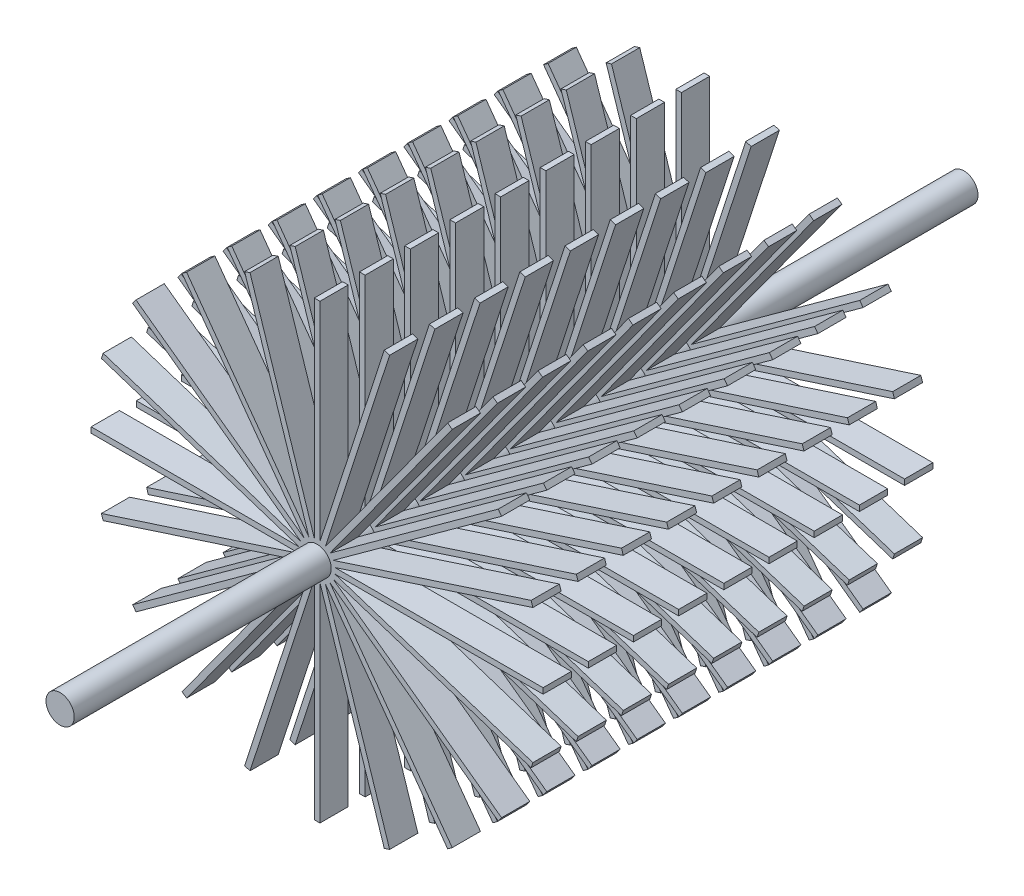
from build123d import *

# Parameters (mm, degrees)
SKETCH_1_R                            = 2.5
EXTRUDE_1_DEPTH                       = 80
SKETCH_2_W                            = 1
SKETCH_2_H                            = 5
EXTRUDE_2_DEPTH                       = 40
PATTERN_CIRCULAR_1_COUNT              = 20
PATTERN_LINEAR_1_COPY_1_SKETCH_W      = 1
PATTERN_LINEAR_1_COPY_1_SKETCH_H      = 5
PATTERN_LINEAR_1_COPY_1_DEPTH         = 40
PATTERN_LINEAR_1_COPY_2_SKETCH_W      = 1
PATTERN_LINEAR_1_COPY_2_SKETCH_H      = 5
PATTERN_LINEAR_1_COPY_2_DEPTH         = 40
PATTERN_LINEAR_1_COPY_3_SKETCH_W      = 1
PATTERN_LINEAR_1_COPY_3_SKETCH_H      = 5
PATTERN_LINEAR_1_COPY_3_DEPTH         = 40
PATTERN_LINEAR_1_COPY_4_SKETCH_W      = 1
PATTERN_LINEAR_1_COPY_4_SKETCH_H      = 5
PATTERN_LINEAR_1_COPY_4_DEPTH         = 40
PATTERN_LINEAR_1_COPY_5_SKETCH_W      = 1
PATTERN_LINEAR_1_COPY_5_SKETCH_H      = 5
PATTERN_LINEAR_1_COPY_5_DEPTH         = 40
PATTERN_LINEAR_1_COPY_6_SKETCH_W      = 1
PATTERN_LINEAR_1_COPY_6_SKETCH_H      = 5
PATTERN_LINEAR_1_COPY_6_DEPTH         = 40
PATTERN_LINEAR_1_COPY_7_SKETCH_W      = 1
PATTERN_LINEAR_1_COPY_7_SKETCH_H      = 5
PATTERN_LINEAR_1_COPY_7_DEPTH         = 40
PATTERN_LINEAR_1_COPY_8_SKETCH_W      = 1
PATTERN_LINEAR_1_COPY_8_SKETCH_H      = 5
PATTERN_LINEAR_1_COPY_8_DEPTH         = 40
PATTERN_LINEAR_1_COPY_9_SKETCH_W      = 1
PATTERN_LINEAR_1_COPY_9_SKETCH_H      = 5
PATTERN_LINEAR_1_COPY_9_DEPTH         = 40
PATTERN_LINEAR_1_COPY_10_SKETCH_W     = 1
PATTERN_LINEAR_1_COPY_10_SKETCH_H     = 5
PATTERN_LINEAR_1_COPY_10_DEPTH        = 40
PATTERN_LINEAR_1_COPY_11_SKETCH_W     = 1
PATTERN_LINEAR_1_COPY_11_SKETCH_H     = 5
PATTERN_LINEAR_1_COPY_11_DEPTH        = 40
PATTERN_LINEAR_1_COPY_12_SKETCH_W     = 1
PATTERN_LINEAR_1_COPY_12_SKETCH_H     = 5
PATTERN_LINEAR_1_COPY_12_DEPTH        = 40
PATTERN_LINEAR_1_COPY_13_SKETCH_W     = 1
PATTERN_LINEAR_1_COPY_13_SKETCH_H     = 5
PATTERN_LINEAR_1_COPY_13_DEPTH        = 40
PATTERN_LINEAR_1_COPY_14_SKETCH_W     = 1
PATTERN_LINEAR_1_COPY_14_SKETCH_H     = 5
PATTERN_LINEAR_1_COPY_14_DEPTH        = 40
PATTERN_LINEAR_1_COPY_15_SKETCH_W     = 1
PATTERN_LINEAR_1_COPY_15_SKETCH_H     = 5
PATTERN_LINEAR_1_COPY_15_DEPTH        = 40
PATTERN_LINEAR_1_COPY_16_SKETCH_W     = 1
PATTERN_LINEAR_1_COPY_16_SKETCH_H     = 5
PATTERN_LINEAR_1_COPY_16_DEPTH        = 40
PATTERN_LINEAR_1_COPY_17_SKETCH_W     = 1
PATTERN_LINEAR_1_COPY_17_SKETCH_H     = 5
PATTERN_LINEAR_1_COPY_17_DEPTH        = 40
PATTERN_LINEAR_1_COPY_18_SKETCH_W     = 1
PATTERN_LINEAR_1_COPY_18_SKETCH_H     = 5
PATTERN_LINEAR_1_COPY_18_DEPTH        = 40
PATTERN_LINEAR_1_COPY_19_SKETCH_W     = 1
PATTERN_LINEAR_1_COPY_19_SKETCH_H     = 5
PATTERN_LINEAR_1_COPY_19_DEPTH        = 40
PATTERN_LINEAR_1_COPY_20_SKETCH_W     = 1
PATTERN_LINEAR_1_COPY_20_SKETCH_H     = 5
PATTERN_LINEAR_1_COPY_20_DEPTH        = 40
PATTERN_LINEAR_1_COPY_21_SKETCH_W     = 1
PATTERN_LINEAR_1_COPY_21_SKETCH_H     = 5
PATTERN_LINEAR_1_COPY_21_DEPTH        = 40
PATTERN_LINEAR_1_COPY_22_SKETCH_W     = 1
PATTERN_LINEAR_1_COPY_22_SKETCH_H     = 5
PATTERN_LINEAR_1_COPY_22_DEPTH        = 40
PATTERN_LINEAR_1_COPY_23_SKETCH_W     = 1
PATTERN_LINEAR_1_COPY_23_SKETCH_H     = 5
PATTERN_LINEAR_1_COPY_23_DEPTH        = 40
PATTERN_LINEAR_1_COPY_24_SKETCH_W     = 1
PATTERN_LINEAR_1_COPY_24_SKETCH_H     = 5
PATTERN_LINEAR_1_COPY_24_DEPTH        = 40
PATTERN_LINEAR_1_COPY_25_SKETCH_W     = 1
PATTERN_LINEAR_1_COPY_25_SKETCH_H     = 5
PATTERN_LINEAR_1_COPY_25_DEPTH        = 40
PATTERN_LINEAR_1_COPY_26_SKETCH_W     = 1
PATTERN_LINEAR_1_COPY_26_SKETCH_H     = 5
PATTERN_LINEAR_1_COPY_26_DEPTH        = 40
PATTERN_LINEAR_1_COPY_27_SKETCH_W     = 1
PATTERN_LINEAR_1_COPY_27_SKETCH_H     = 5
PATTERN_LINEAR_1_COPY_27_DEPTH        = 40
PATTERN_LINEAR_1_COPY_28_SKETCH_W     = 1
PATTERN_LINEAR_1_COPY_28_SKETCH_H     = 5
PATTERN_LINEAR_1_COPY_28_DEPTH        = 40
PATTERN_LINEAR_1_COPY_29_SKETCH_W     = 1
PATTERN_LINEAR_1_COPY_29_SKETCH_H     = 5
PATTERN_LINEAR_1_COPY_29_DEPTH        = 40
PATTERN_LINEAR_1_COPY_30_SKETCH_W     = 1
PATTERN_LINEAR_1_COPY_30_SKETCH_H     = 5
PATTERN_LINEAR_1_COPY_30_DEPTH        = 40
PATTERN_LINEAR_1_COPY_31_SKETCH_W     = 1
PATTERN_LINEAR_1_COPY_31_SKETCH_H     = 5
PATTERN_LINEAR_1_COPY_31_DEPTH        = 40
PATTERN_LINEAR_1_COPY_32_SKETCH_W     = 1
PATTERN_LINEAR_1_COPY_32_SKETCH_H     = 5
PATTERN_LINEAR_1_COPY_32_DEPTH        = 40
PATTERN_LINEAR_1_COPY_33_SKETCH_W     = 1
PATTERN_LINEAR_1_COPY_33_SKETCH_H     = 5
PATTERN_LINEAR_1_COPY_33_DEPTH        = 40
PATTERN_LINEAR_1_COPY_34_SKETCH_W     = 1
PATTERN_LINEAR_1_COPY_34_SKETCH_H     = 5
PATTERN_LINEAR_1_COPY_34_DEPTH        = 40
PATTERN_LINEAR_1_COPY_35_SKETCH_W     = 1
PATTERN_LINEAR_1_COPY_35_SKETCH_H     = 5
PATTERN_LINEAR_1_COPY_35_DEPTH        = 40
PATTERN_LINEAR_1_COPY_36_SKETCH_W     = 1
PATTERN_LINEAR_1_COPY_36_SKETCH_H     = 5
PATTERN_LINEAR_1_COPY_36_DEPTH        = 40
PATTERN_LINEAR_1_COPY_37_SKETCH_W     = 1
PATTERN_LINEAR_1_COPY_37_SKETCH_H     = 5
PATTERN_LINEAR_1_COPY_37_DEPTH        = 40
PATTERN_LINEAR_1_COPY_38_SKETCH_W     = 1
PATTERN_LINEAR_1_COPY_38_SKETCH_H     = 5
PATTERN_LINEAR_1_COPY_38_DEPTH        = 40
PATTERN_LINEAR_1_COPY_39_SKETCH_W     = 1
PATTERN_LINEAR_1_COPY_39_SKETCH_H     = 5
PATTERN_LINEAR_1_COPY_39_DEPTH        = 40
PATTERN_LINEAR_1_COPY_40_SKETCH_W     = 1
PATTERN_LINEAR_1_COPY_40_SKETCH_H     = 5
PATTERN_LINEAR_1_COPY_40_DEPTH        = 40
PATTERN_LINEAR_1_COPY_41_SKETCH_W     = 1
PATTERN_LINEAR_1_COPY_41_SKETCH_H     = 5
PATTERN_LINEAR_1_COPY_41_DEPTH        = 40
PATTERN_LINEAR_1_COPY_42_SKETCH_W     = 1
PATTERN_LINEAR_1_COPY_42_SKETCH_H     = 5
PATTERN_LINEAR_1_COPY_42_DEPTH        = 40
PATTERN_LINEAR_1_COPY_43_SKETCH_W     = 1
PATTERN_LINEAR_1_COPY_43_SKETCH_H     = 5
PATTERN_LINEAR_1_COPY_43_DEPTH        = 40
PATTERN_LINEAR_1_COPY_44_SKETCH_W     = 1
PATTERN_LINEAR_1_COPY_44_SKETCH_H     = 5
PATTERN_LINEAR_1_COPY_44_DEPTH        = 40
PATTERN_LINEAR_1_COPY_45_SKETCH_W     = 1
PATTERN_LINEAR_1_COPY_45_SKETCH_H     = 5
PATTERN_LINEAR_1_COPY_45_DEPTH        = 40
PATTERN_LINEAR_1_COPY_46_SKETCH_W     = 1
PATTERN_LINEAR_1_COPY_46_SKETCH_H     = 5
PATTERN_LINEAR_1_COPY_46_DEPTH        = 40
PATTERN_LINEAR_1_COPY_47_SKETCH_W     = 1
PATTERN_LINEAR_1_COPY_47_SKETCH_H     = 5
PATTERN_LINEAR_1_COPY_47_DEPTH        = 40
PATTERN_LINEAR_1_COPY_48_SKETCH_W     = 1
PATTERN_LINEAR_1_COPY_48_SKETCH_H     = 5
PATTERN_LINEAR_1_COPY_48_DEPTH        = 40
PATTERN_LINEAR_1_COPY_49_SKETCH_W     = 1
PATTERN_LINEAR_1_COPY_49_SKETCH_H     = 5
PATTERN_LINEAR_1_COPY_49_DEPTH        = 40
PATTERN_LINEAR_1_COPY_50_SKETCH_W     = 1
PATTERN_LINEAR_1_COPY_50_SKETCH_H     = 5
PATTERN_LINEAR_1_COPY_50_DEPTH        = 40
PATTERN_LINEAR_1_COPY_51_SKETCH_W     = 1
PATTERN_LINEAR_1_COPY_51_SKETCH_H     = 5
PATTERN_LINEAR_1_COPY_51_DEPTH        = 40
PATTERN_LINEAR_1_COPY_52_SKETCH_W     = 1
PATTERN_LINEAR_1_COPY_52_SKETCH_H     = 5
PATTERN_LINEAR_1_COPY_52_DEPTH        = 40
PATTERN_LINEAR_1_COPY_53_SKETCH_W     = 1
PATTERN_LINEAR_1_COPY_53_SKETCH_H     = 5
PATTERN_LINEAR_1_COPY_53_DEPTH        = 40
PATTERN_LINEAR_1_COPY_54_SKETCH_W     = 1
PATTERN_LINEAR_1_COPY_54_SKETCH_H     = 5
PATTERN_LINEAR_1_COPY_54_DEPTH        = 40
PATTERN_LINEAR_1_COPY_55_SKETCH_W     = 1
PATTERN_LINEAR_1_COPY_55_SKETCH_H     = 5
PATTERN_LINEAR_1_COPY_55_DEPTH        = 40
PATTERN_LINEAR_1_COPY_56_SKETCH_W     = 1
PATTERN_LINEAR_1_COPY_56_SKETCH_H     = 5
PATTERN_LINEAR_1_COPY_56_DEPTH        = 40
PATTERN_LINEAR_1_COPY_57_SKETCH_W     = 1
PATTERN_LINEAR_1_COPY_57_SKETCH_H     = 5
PATTERN_LINEAR_1_COPY_57_DEPTH        = 40
PATTERN_LINEAR_1_COPY_58_SKETCH_W     = 1
PATTERN_LINEAR_1_COPY_58_SKETCH_H     = 5
PATTERN_LINEAR_1_COPY_58_DEPTH        = 40
PATTERN_LINEAR_1_COPY_59_SKETCH_W     = 1
PATTERN_LINEAR_1_COPY_59_SKETCH_H     = 5
PATTERN_LINEAR_1_COPY_59_DEPTH        = 40
PATTERN_LINEAR_1_COPY_60_SKETCH_W     = 1
PATTERN_LINEAR_1_COPY_60_SKETCH_H     = 5
PATTERN_LINEAR_1_COPY_60_DEPTH        = 40
PATTERN_LINEAR_1_COPY_61_SKETCH_W     = 1
PATTERN_LINEAR_1_COPY_61_SKETCH_H     = 5
PATTERN_LINEAR_1_COPY_61_DEPTH        = 40
PATTERN_LINEAR_1_COPY_62_SKETCH_W     = 1
PATTERN_LINEAR_1_COPY_62_SKETCH_H     = 5
PATTERN_LINEAR_1_COPY_62_DEPTH        = 40
PATTERN_LINEAR_1_COPY_63_SKETCH_W     = 1
PATTERN_LINEAR_1_COPY_63_SKETCH_H     = 5
PATTERN_LINEAR_1_COPY_63_DEPTH        = 40
PATTERN_LINEAR_1_COPY_64_SKETCH_W     = 1
PATTERN_LINEAR_1_COPY_64_SKETCH_H     = 5
PATTERN_LINEAR_1_COPY_64_DEPTH        = 40
PATTERN_LINEAR_1_COPY_65_SKETCH_W     = 1
PATTERN_LINEAR_1_COPY_65_SKETCH_H     = 5
PATTERN_LINEAR_1_COPY_65_DEPTH        = 40
PATTERN_LINEAR_1_COPY_66_SKETCH_W     = 1
PATTERN_LINEAR_1_COPY_66_SKETCH_H     = 5
PATTERN_LINEAR_1_COPY_66_DEPTH        = 40
PATTERN_LINEAR_1_COPY_67_SKETCH_W     = 1
PATTERN_LINEAR_1_COPY_67_SKETCH_H     = 5
PATTERN_LINEAR_1_COPY_67_DEPTH        = 40
PATTERN_LINEAR_1_COPY_68_SKETCH_W     = 1
PATTERN_LINEAR_1_COPY_68_SKETCH_H     = 5
PATTERN_LINEAR_1_COPY_68_DEPTH        = 40
PATTERN_LINEAR_1_COPY_69_SKETCH_W     = 1
PATTERN_LINEAR_1_COPY_69_SKETCH_H     = 5
PATTERN_LINEAR_1_COPY_69_DEPTH        = 40
PATTERN_LINEAR_1_COPY_70_SKETCH_W     = 1
PATTERN_LINEAR_1_COPY_70_SKETCH_H     = 5
PATTERN_LINEAR_1_COPY_70_DEPTH        = 40
PATTERN_LINEAR_1_COPY_71_SKETCH_W     = 1
PATTERN_LINEAR_1_COPY_71_SKETCH_H     = 5
PATTERN_LINEAR_1_COPY_71_DEPTH        = 40
PATTERN_LINEAR_1_COPY_72_SKETCH_W     = 1
PATTERN_LINEAR_1_COPY_72_SKETCH_H     = 5
PATTERN_LINEAR_1_COPY_72_DEPTH        = 40
PATTERN_LINEAR_1_COPY_73_SKETCH_W     = 1
PATTERN_LINEAR_1_COPY_73_SKETCH_H     = 5
PATTERN_LINEAR_1_COPY_73_DEPTH        = 40
PATTERN_LINEAR_1_COPY_74_SKETCH_W     = 1
PATTERN_LINEAR_1_COPY_74_SKETCH_H     = 5
PATTERN_LINEAR_1_COPY_74_DEPTH        = 40
PATTERN_LINEAR_1_COPY_75_SKETCH_W     = 1
PATTERN_LINEAR_1_COPY_75_SKETCH_H     = 5
PATTERN_LINEAR_1_COPY_75_DEPTH        = 40
PATTERN_LINEAR_1_COPY_76_SKETCH_W     = 1
PATTERN_LINEAR_1_COPY_76_SKETCH_H     = 5
PATTERN_LINEAR_1_COPY_76_DEPTH        = 40
PATTERN_LINEAR_1_COPY_77_SKETCH_W     = 1
PATTERN_LINEAR_1_COPY_77_SKETCH_H     = 5
PATTERN_LINEAR_1_COPY_77_DEPTH        = 40
PATTERN_LINEAR_1_COPY_78_SKETCH_W     = 1
PATTERN_LINEAR_1_COPY_78_SKETCH_H     = 5
PATTERN_LINEAR_1_COPY_78_DEPTH        = 40
PATTERN_LINEAR_1_COPY_79_SKETCH_W     = 1
PATTERN_LINEAR_1_COPY_79_SKETCH_H     = 5
PATTERN_LINEAR_1_COPY_79_DEPTH        = 40
PATTERN_LINEAR_1_COPY_80_SKETCH_W     = 1
PATTERN_LINEAR_1_COPY_80_SKETCH_H     = 5
PATTERN_LINEAR_1_COPY_80_DEPTH        = 40
PATTERN_LINEAR_1_COL_COPY_1_SKETCH_W  = 1
PATTERN_LINEAR_1_COL_COPY_1_SKETCH_H  = 5
PATTERN_LINEAR_1_COL_COPY_1_DEPTH     = 40
PATTERN_LINEAR_1_COL_COPY_2_SKETCH_W  = 1
PATTERN_LINEAR_1_COL_COPY_2_SKETCH_H  = 5
PATTERN_LINEAR_1_COL_COPY_2_DEPTH     = 40
PATTERN_LINEAR_1_COL_COPY_3_SKETCH_W  = 1
PATTERN_LINEAR_1_COL_COPY_3_SKETCH_H  = 5
PATTERN_LINEAR_1_COL_COPY_3_DEPTH     = 40
PATTERN_LINEAR_1_COL_COPY_4_SKETCH_W  = 1
PATTERN_LINEAR_1_COL_COPY_4_SKETCH_H  = 5
PATTERN_LINEAR_1_COL_COPY_4_DEPTH     = 40
PATTERN_LINEAR_1_COL_COPY_5_SKETCH_W  = 1
PATTERN_LINEAR_1_COL_COPY_5_SKETCH_H  = 5
PATTERN_LINEAR_1_COL_COPY_5_DEPTH     = 40
PATTERN_LINEAR_1_COL_COPY_6_SKETCH_W  = 1
PATTERN_LINEAR_1_COL_COPY_6_SKETCH_H  = 5
PATTERN_LINEAR_1_COL_COPY_6_DEPTH     = 40
PATTERN_LINEAR_1_COL_COPY_7_SKETCH_W  = 1
PATTERN_LINEAR_1_COL_COPY_7_SKETCH_H  = 5
PATTERN_LINEAR_1_COL_COPY_7_DEPTH     = 40
PATTERN_LINEAR_1_COL_COPY_8_SKETCH_W  = 1
PATTERN_LINEAR_1_COL_COPY_8_SKETCH_H  = 5
PATTERN_LINEAR_1_COL_COPY_8_DEPTH     = 40
PATTERN_LINEAR_1_COL_COPY_9_SKETCH_W  = 1
PATTERN_LINEAR_1_COL_COPY_9_SKETCH_H  = 5
PATTERN_LINEAR_1_COL_COPY_9_DEPTH     = 40
PATTERN_LINEAR_1_COL_COPY_10_SKETCH_W = 1
PATTERN_LINEAR_1_COL_COPY_10_SKETCH_H = 5
PATTERN_LINEAR_1_COL_COPY_10_DEPTH    = 40
PATTERN_LINEAR_1_COL_COPY_11_SKETCH_W = 1
PATTERN_LINEAR_1_COL_COPY_11_SKETCH_H = 5
PATTERN_LINEAR_1_COL_COPY_11_DEPTH    = 40
PATTERN_LINEAR_1_COL_COPY_12_SKETCH_W = 1
PATTERN_LINEAR_1_COL_COPY_12_SKETCH_H = 5
PATTERN_LINEAR_1_COL_COPY_12_DEPTH    = 40
PATTERN_LINEAR_1_COL_COPY_13_SKETCH_W = 1
PATTERN_LINEAR_1_COL_COPY_13_SKETCH_H = 5
PATTERN_LINEAR_1_COL_COPY_13_DEPTH    = 40
PATTERN_LINEAR_1_COL_COPY_14_SKETCH_W = 1
PATTERN_LINEAR_1_COL_COPY_14_SKETCH_H = 5
PATTERN_LINEAR_1_COL_COPY_14_DEPTH    = 40
PATTERN_LINEAR_1_COL_COPY_15_SKETCH_W = 1
PATTERN_LINEAR_1_COL_COPY_15_SKETCH_H = 5
PATTERN_LINEAR_1_COL_COPY_15_DEPTH    = 40
PATTERN_LINEAR_1_COL_COPY_16_SKETCH_W = 1
PATTERN_LINEAR_1_COL_COPY_16_SKETCH_H = 5
PATTERN_LINEAR_1_COL_COPY_16_DEPTH    = 40
PATTERN_LINEAR_1_COL_COPY_17_SKETCH_W = 1
PATTERN_LINEAR_1_COL_COPY_17_SKETCH_H = 5
PATTERN_LINEAR_1_COL_COPY_17_DEPTH    = 40
PATTERN_LINEAR_1_COL_COPY_18_SKETCH_W = 1
PATTERN_LINEAR_1_COL_COPY_18_SKETCH_H = 5
PATTERN_LINEAR_1_COL_COPY_18_DEPTH    = 40
PATTERN_LINEAR_1_COL_COPY_19_SKETCH_W = 1
PATTERN_LINEAR_1_COL_COPY_19_SKETCH_H = 5
PATTERN_LINEAR_1_COL_COPY_19_DEPTH    = 40
PATTERN_LINEAR_1_COL_COPY_20_SKETCH_W = 1
PATTERN_LINEAR_1_COL_COPY_20_SKETCH_H = 5
PATTERN_LINEAR_1_COL_COPY_20_DEPTH    = 40
PATTERN_LINEAR_1_COL_COPY_21_SKETCH_W = 1
PATTERN_LINEAR_1_COL_COPY_21_SKETCH_H = 5
PATTERN_LINEAR_1_COL_COPY_21_DEPTH    = 40
PATTERN_LINEAR_1_COL_COPY_22_SKETCH_W = 1
PATTERN_LINEAR_1_COL_COPY_22_SKETCH_H = 5
PATTERN_LINEAR_1_COL_COPY_22_DEPTH    = 40
PATTERN_LINEAR_1_COL_COPY_23_SKETCH_W = 1
PATTERN_LINEAR_1_COL_COPY_23_SKETCH_H = 5
PATTERN_LINEAR_1_COL_COPY_23_DEPTH    = 40
PATTERN_LINEAR_1_COL_COPY_24_SKETCH_W = 1
PATTERN_LINEAR_1_COL_COPY_24_SKETCH_H = 5
PATTERN_LINEAR_1_COL_COPY_24_DEPTH    = 40
PATTERN_LINEAR_1_COL_COPY_25_SKETCH_W = 1
PATTERN_LINEAR_1_COL_COPY_25_SKETCH_H = 5
PATTERN_LINEAR_1_COL_COPY_25_DEPTH    = 40
PATTERN_LINEAR_1_COL_COPY_26_SKETCH_W = 1
PATTERN_LINEAR_1_COL_COPY_26_SKETCH_H = 5
PATTERN_LINEAR_1_COL_COPY_26_DEPTH    = 40
PATTERN_LINEAR_1_COL_COPY_27_SKETCH_W = 1
PATTERN_LINEAR_1_COL_COPY_27_SKETCH_H = 5
PATTERN_LINEAR_1_COL_COPY_27_DEPTH    = 40
PATTERN_LINEAR_1_COL_COPY_28_SKETCH_W = 1
PATTERN_LINEAR_1_COL_COPY_28_SKETCH_H = 5
PATTERN_LINEAR_1_COL_COPY_28_DEPTH    = 40
PATTERN_LINEAR_1_COL_COPY_29_SKETCH_W = 1
PATTERN_LINEAR_1_COL_COPY_29_SKETCH_H = 5
PATTERN_LINEAR_1_COL_COPY_29_DEPTH    = 40
PATTERN_LINEAR_1_COL_COPY_30_SKETCH_W = 1
PATTERN_LINEAR_1_COL_COPY_30_SKETCH_H = 5
PATTERN_LINEAR_1_COL_COPY_30_DEPTH    = 40
PATTERN_LINEAR_1_COL_COPY_31_SKETCH_W = 1
PATTERN_LINEAR_1_COL_COPY_31_SKETCH_H = 5
PATTERN_LINEAR_1_COL_COPY_31_DEPTH    = 40
PATTERN_LINEAR_1_COL_COPY_32_SKETCH_W = 1
PATTERN_LINEAR_1_COL_COPY_32_SKETCH_H = 5
PATTERN_LINEAR_1_COL_COPY_32_DEPTH    = 40
PATTERN_LINEAR_1_COL_COPY_33_SKETCH_W = 1
PATTERN_LINEAR_1_COL_COPY_33_SKETCH_H = 5
PATTERN_LINEAR_1_COL_COPY_33_DEPTH    = 40
PATTERN_LINEAR_1_COL_COPY_34_SKETCH_W = 1
PATTERN_LINEAR_1_COL_COPY_34_SKETCH_H = 5
PATTERN_LINEAR_1_COL_COPY_34_DEPTH    = 40
PATTERN_LINEAR_1_COL_COPY_35_SKETCH_W = 1
PATTERN_LINEAR_1_COL_COPY_35_SKETCH_H = 5
PATTERN_LINEAR_1_COL_COPY_35_DEPTH    = 40
PATTERN_LINEAR_1_COL_COPY_36_SKETCH_W = 1
PATTERN_LINEAR_1_COL_COPY_36_SKETCH_H = 5
PATTERN_LINEAR_1_COL_COPY_36_DEPTH    = 40
PATTERN_LINEAR_1_COL_COPY_37_SKETCH_W = 1
PATTERN_LINEAR_1_COL_COPY_37_SKETCH_H = 5
PATTERN_LINEAR_1_COL_COPY_37_DEPTH    = 40
PATTERN_LINEAR_1_COL_COPY_38_SKETCH_W = 1
PATTERN_LINEAR_1_COL_COPY_38_SKETCH_H = 5
PATTERN_LINEAR_1_COL_COPY_38_DEPTH    = 40
PATTERN_LINEAR_1_COL_COPY_39_SKETCH_W = 1
PATTERN_LINEAR_1_COL_COPY_39_SKETCH_H = 5
PATTERN_LINEAR_1_COL_COPY_39_DEPTH    = 40
PATTERN_LINEAR_1_COL_COPY_40_SKETCH_W = 1
PATTERN_LINEAR_1_COL_COPY_40_SKETCH_H = 5
PATTERN_LINEAR_1_COL_COPY_40_DEPTH    = 40
PATTERN_LINEAR_1_COL_COPY_41_SKETCH_W = 1
PATTERN_LINEAR_1_COL_COPY_41_SKETCH_H = 5
PATTERN_LINEAR_1_COL_COPY_41_DEPTH    = 40
PATTERN_LINEAR_1_COL_COPY_42_SKETCH_W = 1
PATTERN_LINEAR_1_COL_COPY_42_SKETCH_H = 5
PATTERN_LINEAR_1_COL_COPY_42_DEPTH    = 40
PATTERN_LINEAR_1_COL_COPY_43_SKETCH_W = 1
PATTERN_LINEAR_1_COL_COPY_43_SKETCH_H = 5
PATTERN_LINEAR_1_COL_COPY_43_DEPTH    = 40
PATTERN_LINEAR_1_COL_COPY_44_SKETCH_W = 1
PATTERN_LINEAR_1_COL_COPY_44_SKETCH_H = 5
PATTERN_LINEAR_1_COL_COPY_44_DEPTH    = 40
PATTERN_LINEAR_1_COL_COPY_45_SKETCH_W = 1
PATTERN_LINEAR_1_COL_COPY_45_SKETCH_H = 5
PATTERN_LINEAR_1_COL_COPY_45_DEPTH    = 40
PATTERN_LINEAR_1_COL_COPY_46_SKETCH_W = 1
PATTERN_LINEAR_1_COL_COPY_46_SKETCH_H = 5
PATTERN_LINEAR_1_COL_COPY_46_DEPTH    = 40
PATTERN_LINEAR_1_COL_COPY_47_SKETCH_W = 1
PATTERN_LINEAR_1_COL_COPY_47_SKETCH_H = 5
PATTERN_LINEAR_1_COL_COPY_47_DEPTH    = 40
PATTERN_LINEAR_1_COL_COPY_48_SKETCH_W = 1
PATTERN_LINEAR_1_COL_COPY_48_SKETCH_H = 5
PATTERN_LINEAR_1_COL_COPY_48_DEPTH    = 40
PATTERN_LINEAR_1_COL_COPY_49_SKETCH_W = 1
PATTERN_LINEAR_1_COL_COPY_49_SKETCH_H = 5
PATTERN_LINEAR_1_COL_COPY_49_DEPTH    = 40
PATTERN_LINEAR_1_COL_COPY_50_SKETCH_W = 1
PATTERN_LINEAR_1_COL_COPY_50_SKETCH_H = 5
PATTERN_LINEAR_1_COL_COPY_50_DEPTH    = 40
PATTERN_LINEAR_1_COL_COPY_51_SKETCH_W = 1
PATTERN_LINEAR_1_COL_COPY_51_SKETCH_H = 5
PATTERN_LINEAR_1_COL_COPY_51_DEPTH    = 40
PATTERN_LINEAR_1_COL_COPY_52_SKETCH_W = 1
PATTERN_LINEAR_1_COL_COPY_52_SKETCH_H = 5
PATTERN_LINEAR_1_COL_COPY_52_DEPTH    = 40
PATTERN_LINEAR_1_COL_COPY_53_SKETCH_W = 1
PATTERN_LINEAR_1_COL_COPY_53_SKETCH_H = 5
PATTERN_LINEAR_1_COL_COPY_53_DEPTH    = 40
PATTERN_LINEAR_1_COL_COPY_54_SKETCH_W = 1
PATTERN_LINEAR_1_COL_COPY_54_SKETCH_H = 5
PATTERN_LINEAR_1_COL_COPY_54_DEPTH    = 40
PATTERN_LINEAR_1_COL_COPY_55_SKETCH_W = 1
PATTERN_LINEAR_1_COL_COPY_55_SKETCH_H = 5
PATTERN_LINEAR_1_COL_COPY_55_DEPTH    = 40
PATTERN_LINEAR_1_COL_COPY_56_SKETCH_W = 1
PATTERN_LINEAR_1_COL_COPY_56_SKETCH_H = 5
PATTERN_LINEAR_1_COL_COPY_56_DEPTH    = 40
PATTERN_LINEAR_1_COL_COPY_57_SKETCH_W = 1
PATTERN_LINEAR_1_COL_COPY_57_SKETCH_H = 5
PATTERN_LINEAR_1_COL_COPY_57_DEPTH    = 40
PATTERN_LINEAR_1_COL_COPY_58_SKETCH_W = 1
PATTERN_LINEAR_1_COL_COPY_58_SKETCH_H = 5
PATTERN_LINEAR_1_COL_COPY_58_DEPTH    = 40
PATTERN_LINEAR_1_COL_COPY_59_SKETCH_W = 1
PATTERN_LINEAR_1_COL_COPY_59_SKETCH_H = 5
PATTERN_LINEAR_1_COL_COPY_59_DEPTH    = 40
PATTERN_LINEAR_1_COL_COPY_60_SKETCH_W = 1
PATTERN_LINEAR_1_COL_COPY_60_SKETCH_H = 5
PATTERN_LINEAR_1_COL_COPY_60_DEPTH    = 40
PATTERN_LINEAR_1_COL_COPY_61_SKETCH_W = 1
PATTERN_LINEAR_1_COL_COPY_61_SKETCH_H = 5
PATTERN_LINEAR_1_COL_COPY_61_DEPTH    = 40
PATTERN_LINEAR_1_COL_COPY_62_SKETCH_W = 1
PATTERN_LINEAR_1_COL_COPY_62_SKETCH_H = 5
PATTERN_LINEAR_1_COL_COPY_62_DEPTH    = 40
PATTERN_LINEAR_1_COL_COPY_63_SKETCH_W = 1
PATTERN_LINEAR_1_COL_COPY_63_SKETCH_H = 5
PATTERN_LINEAR_1_COL_COPY_63_DEPTH    = 40
PATTERN_LINEAR_1_COL_COPY_64_SKETCH_W = 1
PATTERN_LINEAR_1_COL_COPY_64_SKETCH_H = 5
PATTERN_LINEAR_1_COL_COPY_64_DEPTH    = 40
PATTERN_LINEAR_1_COL_COPY_65_SKETCH_W = 1
PATTERN_LINEAR_1_COL_COPY_65_SKETCH_H = 5
PATTERN_LINEAR_1_COL_COPY_65_DEPTH    = 40
PATTERN_LINEAR_1_COL_COPY_66_SKETCH_W = 1
PATTERN_LINEAR_1_COL_COPY_66_SKETCH_H = 5
PATTERN_LINEAR_1_COL_COPY_66_DEPTH    = 40
PATTERN_LINEAR_1_COL_COPY_67_SKETCH_W = 1
PATTERN_LINEAR_1_COL_COPY_67_SKETCH_H = 5
PATTERN_LINEAR_1_COL_COPY_67_DEPTH    = 40
PATTERN_LINEAR_1_COL_COPY_68_SKETCH_W = 1
PATTERN_LINEAR_1_COL_COPY_68_SKETCH_H = 5
PATTERN_LINEAR_1_COL_COPY_68_DEPTH    = 40
PATTERN_LINEAR_1_COL_COPY_69_SKETCH_W = 1
PATTERN_LINEAR_1_COL_COPY_69_SKETCH_H = 5
PATTERN_LINEAR_1_COL_COPY_69_DEPTH    = 40
PATTERN_LINEAR_1_COL_COPY_70_SKETCH_W = 1
PATTERN_LINEAR_1_COL_COPY_70_SKETCH_H = 5
PATTERN_LINEAR_1_COL_COPY_70_DEPTH    = 40
PATTERN_LINEAR_1_COL_COPY_71_SKETCH_W = 1
PATTERN_LINEAR_1_COL_COPY_71_SKETCH_H = 5
PATTERN_LINEAR_1_COL_COPY_71_DEPTH    = 40
PATTERN_LINEAR_1_COL_COPY_72_SKETCH_W = 1
PATTERN_LINEAR_1_COL_COPY_72_SKETCH_H = 5
PATTERN_LINEAR_1_COL_COPY_72_DEPTH    = 40
PATTERN_LINEAR_1_COL_COPY_73_SKETCH_W = 1
PATTERN_LINEAR_1_COL_COPY_73_SKETCH_H = 5
PATTERN_LINEAR_1_COL_COPY_73_DEPTH    = 40
PATTERN_LINEAR_1_COL_COPY_74_SKETCH_W = 1
PATTERN_LINEAR_1_COL_COPY_74_SKETCH_H = 5
PATTERN_LINEAR_1_COL_COPY_74_DEPTH    = 40
PATTERN_LINEAR_1_COL_COPY_75_SKETCH_W = 1
PATTERN_LINEAR_1_COL_COPY_75_SKETCH_H = 5
PATTERN_LINEAR_1_COL_COPY_75_DEPTH    = 40
PATTERN_LINEAR_1_COL_COPY_76_SKETCH_W = 1
PATTERN_LINEAR_1_COL_COPY_76_SKETCH_H = 5
PATTERN_LINEAR_1_COL_COPY_76_DEPTH    = 40
PATTERN_LINEAR_1_COL_COPY_77_SKETCH_W = 1
PATTERN_LINEAR_1_COL_COPY_77_SKETCH_H = 5
PATTERN_LINEAR_1_COL_COPY_77_DEPTH    = 40
PATTERN_LINEAR_1_COL_COPY_78_SKETCH_W = 1
PATTERN_LINEAR_1_COL_COPY_78_SKETCH_H = 5
PATTERN_LINEAR_1_COL_COPY_78_DEPTH    = 40
PATTERN_LINEAR_1_COL_COPY_79_SKETCH_W = 1
PATTERN_LINEAR_1_COL_COPY_79_SKETCH_H = 5
PATTERN_LINEAR_1_COL_COPY_79_DEPTH    = 40
PATTERN_LINEAR_1_COL_COPY_80_SKETCH_W = 1
PATTERN_LINEAR_1_COL_COPY_80_SKETCH_H = 5
PATTERN_LINEAR_1_COL_COPY_80_DEPTH    = 40


with BuildPart() as part:
    # 草图1 → 凸台-拉伸1 (new, symmetric)
    with BuildSketch(Plane.XY):
        Circle(SKETCH_1_R)
    extrude(amount=EXTRUDE_1_DEPTH, both=True)

    # 草图2 → 凸台-拉伸2 (add)
    with BuildSketch(Plane(origin=(0, 0, 0), x_dir=(1, 0, 0), z_dir=(0, 1, 0))):
        Rectangle(SKETCH_2_W, SKETCH_2_H)
    extrude_2 = extrude(amount=EXTRUDE_2_DEPTH)

    # 阵列(圆周)1: 凸台-拉伸2 ×20 about axis
    pattern_circular_1_axis = Axis((0, 0, 80), (0, 0, -1))
    for i in range(1, PATTERN_CIRCULAR_1_COUNT):
        add(extrude_2.rotate(pattern_circular_1_axis, i * 360 / PATTERN_CIRCULAR_1_COUNT))

    # 阵列(线性)1 copy 1 sketch → 阵列(线性)1 copy 1 (add)
    with BuildSketch(Plane(origin=(0, 0, -8), x_dir=(0.9510565162951535, -0.3090169943749474, 0), z_dir=(0.3090169943749474, 0.9510565162951535, 0))):
        Rectangle(PATTERN_LINEAR_1_COPY_1_SKETCH_W, PATTERN_LINEAR_1_COPY_1_SKETCH_H)
    extrude(amount=PATTERN_LINEAR_1_COPY_1_DEPTH)

    # 阵列(线性)1 copy 2 sketch → 阵列(线性)1 copy 2 (add)
    with BuildSketch(Plane(origin=(0, 0, -16), x_dir=(0.9510565162951535, -0.3090169943749474, 0), z_dir=(0.3090169943749474, 0.9510565162951535, 0))):
        Rectangle(PATTERN_LINEAR_1_COPY_2_SKETCH_W, PATTERN_LINEAR_1_COPY_2_SKETCH_H)
    extrude(amount=PATTERN_LINEAR_1_COPY_2_DEPTH)

    # 阵列(线性)1 copy 3 sketch → 阵列(线性)1 copy 3 (add)
    with BuildSketch(Plane(origin=(0, 0, -24), x_dir=(0.9510565162951535, -0.3090169943749474, 0), z_dir=(0.3090169943749474, 0.9510565162951535, 0))):
        Rectangle(PATTERN_LINEAR_1_COPY_3_SKETCH_W, PATTERN_LINEAR_1_COPY_3_SKETCH_H)
    extrude(amount=PATTERN_LINEAR_1_COPY_3_DEPTH)

    # 阵列(线性)1 copy 4 sketch → 阵列(线性)1 copy 4 (add)
    with BuildSketch(Plane(origin=(0, 0, -32), x_dir=(0.9510565162951535, -0.3090169943749474, 0), z_dir=(0.3090169943749474, 0.9510565162951535, 0))):
        Rectangle(PATTERN_LINEAR_1_COPY_4_SKETCH_W, PATTERN_LINEAR_1_COPY_4_SKETCH_H)
    extrude(amount=PATTERN_LINEAR_1_COPY_4_DEPTH)

    # 阵列(线性)1 copy 5 sketch → 阵列(线性)1 copy 5 (add)
    with BuildSketch(Plane(origin=(0, 0, -8), x_dir=(0.8090169943749475, -0.5877852522924731, 0), z_dir=(0.5877852522924731, 0.8090169943749475, 0))):
        Rectangle(PATTERN_LINEAR_1_COPY_5_SKETCH_W, PATTERN_LINEAR_1_COPY_5_SKETCH_H)
    extrude(amount=PATTERN_LINEAR_1_COPY_5_DEPTH)

    # 阵列(线性)1 copy 6 sketch → 阵列(线性)1 copy 6 (add)
    with BuildSketch(Plane(origin=(0, 0, -16), x_dir=(0.8090169943749475, -0.5877852522924731, 0), z_dir=(0.5877852522924731, 0.8090169943749475, 0))):
        Rectangle(PATTERN_LINEAR_1_COPY_6_SKETCH_W, PATTERN_LINEAR_1_COPY_6_SKETCH_H)
    extrude(amount=PATTERN_LINEAR_1_COPY_6_DEPTH)

    # 阵列(线性)1 copy 7 sketch → 阵列(线性)1 copy 7 (add)
    with BuildSketch(Plane(origin=(0, 0, -24), x_dir=(0.8090169943749475, -0.5877852522924731, 0), z_dir=(0.5877852522924731, 0.8090169943749475, 0))):
        Rectangle(PATTERN_LINEAR_1_COPY_7_SKETCH_W, PATTERN_LINEAR_1_COPY_7_SKETCH_H)
    extrude(amount=PATTERN_LINEAR_1_COPY_7_DEPTH)

    # 阵列(线性)1 copy 8 sketch → 阵列(线性)1 copy 8 (add)
    with BuildSketch(Plane(origin=(0, 0, -32), x_dir=(0.8090169943749475, -0.5877852522924731, 0), z_dir=(0.5877852522924731, 0.8090169943749475, 0))):
        Rectangle(PATTERN_LINEAR_1_COPY_8_SKETCH_W, PATTERN_LINEAR_1_COPY_8_SKETCH_H)
    extrude(amount=PATTERN_LINEAR_1_COPY_8_DEPTH)

    # 阵列(线性)1 copy 9 sketch → 阵列(线性)1 copy 9 (add)
    with BuildSketch(Plane(origin=(0, 0, -8), x_dir=(0.5877852522924731, -0.8090169943749475, 0), z_dir=(0.8090169943749475, 0.5877852522924731, 0))):
        Rectangle(PATTERN_LINEAR_1_COPY_9_SKETCH_W, PATTERN_LINEAR_1_COPY_9_SKETCH_H)
    extrude(amount=PATTERN_LINEAR_1_COPY_9_DEPTH)

    # 阵列(线性)1 copy 10 sketch → 阵列(线性)1 copy 10 (add)
    with BuildSketch(Plane(origin=(0, 0, -16), x_dir=(0.5877852522924731, -0.8090169943749475, 0), z_dir=(0.8090169943749475, 0.5877852522924731, 0))):
        Rectangle(PATTERN_LINEAR_1_COPY_10_SKETCH_W, PATTERN_LINEAR_1_COPY_10_SKETCH_H)
    extrude(amount=PATTERN_LINEAR_1_COPY_10_DEPTH)

    # 阵列(线性)1 copy 11 sketch → 阵列(线性)1 copy 11 (add)
    with BuildSketch(Plane(origin=(0, 0, -24), x_dir=(0.5877852522924731, -0.8090169943749475, 0), z_dir=(0.8090169943749475, 0.5877852522924731, 0))):
        Rectangle(PATTERN_LINEAR_1_COPY_11_SKETCH_W, PATTERN_LINEAR_1_COPY_11_SKETCH_H)
    extrude(amount=PATTERN_LINEAR_1_COPY_11_DEPTH)

    # 阵列(线性)1 copy 12 sketch → 阵列(线性)1 copy 12 (add)
    with BuildSketch(Plane(origin=(0, 0, -32), x_dir=(0.5877852522924731, -0.8090169943749475, 0), z_dir=(0.8090169943749475, 0.5877852522924731, 0))):
        Rectangle(PATTERN_LINEAR_1_COPY_12_SKETCH_W, PATTERN_LINEAR_1_COPY_12_SKETCH_H)
    extrude(amount=PATTERN_LINEAR_1_COPY_12_DEPTH)

    # 阵列(线性)1 copy 13 sketch → 阵列(线性)1 copy 13 (add)
    with BuildSketch(Plane(origin=(0, 0, -8), x_dir=(0.30901699437494745, -0.9510565162951535, 0), z_dir=(0.9510565162951535, 0.30901699437494745, 0))):
        Rectangle(PATTERN_LINEAR_1_COPY_13_SKETCH_W, PATTERN_LINEAR_1_COPY_13_SKETCH_H)
    extrude(amount=PATTERN_LINEAR_1_COPY_13_DEPTH)

    # 阵列(线性)1 copy 14 sketch → 阵列(线性)1 copy 14 (add)
    with BuildSketch(Plane(origin=(0, 0, -16), x_dir=(0.30901699437494745, -0.9510565162951535, 0), z_dir=(0.9510565162951535, 0.30901699437494745, 0))):
        Rectangle(PATTERN_LINEAR_1_COPY_14_SKETCH_W, PATTERN_LINEAR_1_COPY_14_SKETCH_H)
    extrude(amount=PATTERN_LINEAR_1_COPY_14_DEPTH)

    # 阵列(线性)1 copy 15 sketch → 阵列(线性)1 copy 15 (add)
    with BuildSketch(Plane(origin=(0, 0, -24), x_dir=(0.30901699437494745, -0.9510565162951535, 0), z_dir=(0.9510565162951535, 0.30901699437494745, 0))):
        Rectangle(PATTERN_LINEAR_1_COPY_15_SKETCH_W, PATTERN_LINEAR_1_COPY_15_SKETCH_H)
    extrude(amount=PATTERN_LINEAR_1_COPY_15_DEPTH)

    # 阵列(线性)1 copy 16 sketch → 阵列(线性)1 copy 16 (add)
    with BuildSketch(Plane(origin=(0, 0, -32), x_dir=(0.30901699437494745, -0.9510565162951535, 0), z_dir=(0.9510565162951535, 0.30901699437494745, 0))):
        Rectangle(PATTERN_LINEAR_1_COPY_16_SKETCH_W, PATTERN_LINEAR_1_COPY_16_SKETCH_H)
    extrude(amount=PATTERN_LINEAR_1_COPY_16_DEPTH)

    # 阵列(线性)1 copy 17 sketch → 阵列(线性)1 copy 17 (add)
    with BuildSketch(Plane(origin=(0, 0, -8), x_dir=(0, -1, 0), z_dir=(1, 0, 0))):
        Rectangle(PATTERN_LINEAR_1_COPY_17_SKETCH_W, PATTERN_LINEAR_1_COPY_17_SKETCH_H)
    extrude(amount=PATTERN_LINEAR_1_COPY_17_DEPTH)

    # 阵列(线性)1 copy 18 sketch → 阵列(线性)1 copy 18 (add)
    with BuildSketch(Plane(origin=(0, 0, -16), x_dir=(0, -1, 0), z_dir=(1, 0, 0))):
        Rectangle(PATTERN_LINEAR_1_COPY_18_SKETCH_W, PATTERN_LINEAR_1_COPY_18_SKETCH_H)
    extrude(amount=PATTERN_LINEAR_1_COPY_18_DEPTH)

    # 阵列(线性)1 copy 19 sketch → 阵列(线性)1 copy 19 (add)
    with BuildSketch(Plane(origin=(0, 0, -24), x_dir=(0, -1, 0), z_dir=(1, 0, 0))):
        Rectangle(PATTERN_LINEAR_1_COPY_19_SKETCH_W, PATTERN_LINEAR_1_COPY_19_SKETCH_H)
    extrude(amount=PATTERN_LINEAR_1_COPY_19_DEPTH)

    # 阵列(线性)1 copy 20 sketch → 阵列(线性)1 copy 20 (add)
    with BuildSketch(Plane(origin=(0, 0, -32), x_dir=(0, -1, 0), z_dir=(1, 0, 0))):
        Rectangle(PATTERN_LINEAR_1_COPY_20_SKETCH_W, PATTERN_LINEAR_1_COPY_20_SKETCH_H)
    extrude(amount=PATTERN_LINEAR_1_COPY_20_DEPTH)

    # 阵列(线性)1 copy 21 sketch → 阵列(线性)1 copy 21 (add)
    with BuildSketch(Plane(origin=(0, 0, -8), x_dir=(-0.30901699437494734, -0.9510565162951536, 0), z_dir=(0.9510565162951536, -0.30901699437494734, 0))):
        Rectangle(PATTERN_LINEAR_1_COPY_21_SKETCH_W, PATTERN_LINEAR_1_COPY_21_SKETCH_H)
    extrude(amount=PATTERN_LINEAR_1_COPY_21_DEPTH)

    # 阵列(线性)1 copy 22 sketch → 阵列(线性)1 copy 22 (add)
    with BuildSketch(Plane(origin=(0, 0, -16), x_dir=(-0.30901699437494734, -0.9510565162951536, 0), z_dir=(0.9510565162951536, -0.30901699437494734, 0))):
        Rectangle(PATTERN_LINEAR_1_COPY_22_SKETCH_W, PATTERN_LINEAR_1_COPY_22_SKETCH_H)
    extrude(amount=PATTERN_LINEAR_1_COPY_22_DEPTH)

    # 阵列(线性)1 copy 23 sketch → 阵列(线性)1 copy 23 (add)
    with BuildSketch(Plane(origin=(0, 0, -24), x_dir=(-0.30901699437494734, -0.9510565162951536, 0), z_dir=(0.9510565162951536, -0.30901699437494734, 0))):
        Rectangle(PATTERN_LINEAR_1_COPY_23_SKETCH_W, PATTERN_LINEAR_1_COPY_23_SKETCH_H)
    extrude(amount=PATTERN_LINEAR_1_COPY_23_DEPTH)

    # 阵列(线性)1 copy 24 sketch → 阵列(线性)1 copy 24 (add)
    with BuildSketch(Plane(origin=(0, 0, -32), x_dir=(-0.30901699437494734, -0.9510565162951536, 0), z_dir=(0.9510565162951536, -0.30901699437494734, 0))):
        Rectangle(PATTERN_LINEAR_1_COPY_24_SKETCH_W, PATTERN_LINEAR_1_COPY_24_SKETCH_H)
    extrude(amount=PATTERN_LINEAR_1_COPY_24_DEPTH)

    # 阵列(线性)1 copy 25 sketch → 阵列(线性)1 copy 25 (add)
    with BuildSketch(Plane(origin=(0, 0, -8), x_dir=(-0.587785252292473, -0.8090169943749475, 0), z_dir=(0.8090169943749475, -0.587785252292473, 0))):
        Rectangle(PATTERN_LINEAR_1_COPY_25_SKETCH_W, PATTERN_LINEAR_1_COPY_25_SKETCH_H)
    extrude(amount=PATTERN_LINEAR_1_COPY_25_DEPTH)

    # 阵列(线性)1 copy 26 sketch → 阵列(线性)1 copy 26 (add)
    with BuildSketch(Plane(origin=(0, 0, -16), x_dir=(-0.587785252292473, -0.8090169943749475, 0), z_dir=(0.8090169943749475, -0.587785252292473, 0))):
        Rectangle(PATTERN_LINEAR_1_COPY_26_SKETCH_W, PATTERN_LINEAR_1_COPY_26_SKETCH_H)
    extrude(amount=PATTERN_LINEAR_1_COPY_26_DEPTH)

    # 阵列(线性)1 copy 27 sketch → 阵列(线性)1 copy 27 (add)
    with BuildSketch(Plane(origin=(0, 0, -24), x_dir=(-0.587785252292473, -0.8090169943749475, 0), z_dir=(0.8090169943749475, -0.587785252292473, 0))):
        Rectangle(PATTERN_LINEAR_1_COPY_27_SKETCH_W, PATTERN_LINEAR_1_COPY_27_SKETCH_H)
    extrude(amount=PATTERN_LINEAR_1_COPY_27_DEPTH)

    # 阵列(线性)1 copy 28 sketch → 阵列(线性)1 copy 28 (add)
    with BuildSketch(Plane(origin=(0, 0, -32), x_dir=(-0.587785252292473, -0.8090169943749475, 0), z_dir=(0.8090169943749475, -0.587785252292473, 0))):
        Rectangle(PATTERN_LINEAR_1_COPY_28_SKETCH_W, PATTERN_LINEAR_1_COPY_28_SKETCH_H)
    extrude(amount=PATTERN_LINEAR_1_COPY_28_DEPTH)

    # 阵列(线性)1 copy 29 sketch → 阵列(线性)1 copy 29 (add)
    with BuildSketch(Plane(origin=(0, 0, -8), x_dir=(-0.8090169943749473, -0.5877852522924732, 0), z_dir=(0.5877852522924732, -0.8090169943749473, 0))):
        Rectangle(PATTERN_LINEAR_1_COPY_29_SKETCH_W, PATTERN_LINEAR_1_COPY_29_SKETCH_H)
    extrude(amount=PATTERN_LINEAR_1_COPY_29_DEPTH)

    # 阵列(线性)1 copy 30 sketch → 阵列(线性)1 copy 30 (add)
    with BuildSketch(Plane(origin=(0, 0, -16), x_dir=(-0.8090169943749473, -0.5877852522924732, 0), z_dir=(0.5877852522924732, -0.8090169943749473, 0))):
        Rectangle(PATTERN_LINEAR_1_COPY_30_SKETCH_W, PATTERN_LINEAR_1_COPY_30_SKETCH_H)
    extrude(amount=PATTERN_LINEAR_1_COPY_30_DEPTH)

    # 阵列(线性)1 copy 31 sketch → 阵列(线性)1 copy 31 (add)
    with BuildSketch(Plane(origin=(0, 0, -24), x_dir=(-0.8090169943749473, -0.5877852522924732, 0), z_dir=(0.5877852522924732, -0.8090169943749473, 0))):
        Rectangle(PATTERN_LINEAR_1_COPY_31_SKETCH_W, PATTERN_LINEAR_1_COPY_31_SKETCH_H)
    extrude(amount=PATTERN_LINEAR_1_COPY_31_DEPTH)

    # 阵列(线性)1 copy 32 sketch → 阵列(线性)1 copy 32 (add)
    with BuildSketch(Plane(origin=(0, 0, -32), x_dir=(-0.8090169943749473, -0.5877852522924732, 0), z_dir=(0.5877852522924732, -0.8090169943749473, 0))):
        Rectangle(PATTERN_LINEAR_1_COPY_32_SKETCH_W, PATTERN_LINEAR_1_COPY_32_SKETCH_H)
    extrude(amount=PATTERN_LINEAR_1_COPY_32_DEPTH)

    # 阵列(线性)1 copy 33 sketch → 阵列(线性)1 copy 33 (add)
    with BuildSketch(Plane(origin=(0, 0, -8), x_dir=(-0.9510565162951535, -0.3090169943749475, 0), z_dir=(0.3090169943749475, -0.9510565162951535, 0))):
        Rectangle(PATTERN_LINEAR_1_COPY_33_SKETCH_W, PATTERN_LINEAR_1_COPY_33_SKETCH_H)
    extrude(amount=PATTERN_LINEAR_1_COPY_33_DEPTH)

    # 阵列(线性)1 copy 34 sketch → 阵列(线性)1 copy 34 (add)
    with BuildSketch(Plane(origin=(0, 0, -16), x_dir=(-0.9510565162951535, -0.3090169943749475, 0), z_dir=(0.3090169943749475, -0.9510565162951535, 0))):
        Rectangle(PATTERN_LINEAR_1_COPY_34_SKETCH_W, PATTERN_LINEAR_1_COPY_34_SKETCH_H)
    extrude(amount=PATTERN_LINEAR_1_COPY_34_DEPTH)

    # 阵列(线性)1 copy 35 sketch → 阵列(线性)1 copy 35 (add)
    with BuildSketch(Plane(origin=(0, 0, -24), x_dir=(-0.9510565162951535, -0.3090169943749475, 0), z_dir=(0.3090169943749475, -0.9510565162951535, 0))):
        Rectangle(PATTERN_LINEAR_1_COPY_35_SKETCH_W, PATTERN_LINEAR_1_COPY_35_SKETCH_H)
    extrude(amount=PATTERN_LINEAR_1_COPY_35_DEPTH)

    # 阵列(线性)1 copy 36 sketch → 阵列(线性)1 copy 36 (add)
    with BuildSketch(Plane(origin=(0, 0, -32), x_dir=(-0.9510565162951535, -0.3090169943749475, 0), z_dir=(0.3090169943749475, -0.9510565162951535, 0))):
        Rectangle(PATTERN_LINEAR_1_COPY_36_SKETCH_W, PATTERN_LINEAR_1_COPY_36_SKETCH_H)
    extrude(amount=PATTERN_LINEAR_1_COPY_36_DEPTH)

    # 阵列(线性)1 copy 37 sketch → 阵列(线性)1 copy 37 (add)
    with BuildSketch(Plane(origin=(0, 0, -8), x_dir=(-1, 0, 0), z_dir=(0, -1, 0))):
        Rectangle(PATTERN_LINEAR_1_COPY_37_SKETCH_W, PATTERN_LINEAR_1_COPY_37_SKETCH_H)
    extrude(amount=PATTERN_LINEAR_1_COPY_37_DEPTH)

    # 阵列(线性)1 copy 38 sketch → 阵列(线性)1 copy 38 (add)
    with BuildSketch(Plane(origin=(0, 0, -16), x_dir=(-1, 0, 0), z_dir=(0, -1, 0))):
        Rectangle(PATTERN_LINEAR_1_COPY_38_SKETCH_W, PATTERN_LINEAR_1_COPY_38_SKETCH_H)
    extrude(amount=PATTERN_LINEAR_1_COPY_38_DEPTH)

    # 阵列(线性)1 copy 39 sketch → 阵列(线性)1 copy 39 (add)
    with BuildSketch(Plane(origin=(0, 0, -24), x_dir=(-1, 0, 0), z_dir=(0, -1, 0))):
        Rectangle(PATTERN_LINEAR_1_COPY_39_SKETCH_W, PATTERN_LINEAR_1_COPY_39_SKETCH_H)
    extrude(amount=PATTERN_LINEAR_1_COPY_39_DEPTH)

    # 阵列(线性)1 copy 40 sketch → 阵列(线性)1 copy 40 (add)
    with BuildSketch(Plane(origin=(0, 0, -32), x_dir=(-1, 0, 0), z_dir=(0, -1, 0))):
        Rectangle(PATTERN_LINEAR_1_COPY_40_SKETCH_W, PATTERN_LINEAR_1_COPY_40_SKETCH_H)
    extrude(amount=PATTERN_LINEAR_1_COPY_40_DEPTH)

    # 阵列(线性)1 copy 41 sketch → 阵列(线性)1 copy 41 (add)
    with BuildSketch(Plane(origin=(0, 0, -8), x_dir=(-0.9510565162951536, 0.3090169943749473, 0), z_dir=(-0.3090169943749473, -0.9510565162951536, 0))):
        Rectangle(PATTERN_LINEAR_1_COPY_41_SKETCH_W, PATTERN_LINEAR_1_COPY_41_SKETCH_H)
    extrude(amount=PATTERN_LINEAR_1_COPY_41_DEPTH)

    # 阵列(线性)1 copy 42 sketch → 阵列(线性)1 copy 42 (add)
    with BuildSketch(Plane(origin=(0, 0, -16), x_dir=(-0.9510565162951536, 0.3090169943749473, 0), z_dir=(-0.3090169943749473, -0.9510565162951536, 0))):
        Rectangle(PATTERN_LINEAR_1_COPY_42_SKETCH_W, PATTERN_LINEAR_1_COPY_42_SKETCH_H)
    extrude(amount=PATTERN_LINEAR_1_COPY_42_DEPTH)

    # 阵列(线性)1 copy 43 sketch → 阵列(线性)1 copy 43 (add)
    with BuildSketch(Plane(origin=(0, 0, -24), x_dir=(-0.9510565162951536, 0.3090169943749473, 0), z_dir=(-0.3090169943749473, -0.9510565162951536, 0))):
        Rectangle(PATTERN_LINEAR_1_COPY_43_SKETCH_W, PATTERN_LINEAR_1_COPY_43_SKETCH_H)
    extrude(amount=PATTERN_LINEAR_1_COPY_43_DEPTH)

    # 阵列(线性)1 copy 44 sketch → 阵列(线性)1 copy 44 (add)
    with BuildSketch(Plane(origin=(0, 0, -32), x_dir=(-0.9510565162951536, 0.3090169943749473, 0), z_dir=(-0.3090169943749473, -0.9510565162951536, 0))):
        Rectangle(PATTERN_LINEAR_1_COPY_44_SKETCH_W, PATTERN_LINEAR_1_COPY_44_SKETCH_H)
    extrude(amount=PATTERN_LINEAR_1_COPY_44_DEPTH)

    # 阵列(线性)1 copy 45 sketch → 阵列(线性)1 copy 45 (add)
    with BuildSketch(Plane(origin=(0, 0, -8), x_dir=(-0.8090169943749476, 0.587785252292473, 0), z_dir=(-0.587785252292473, -0.8090169943749476, 0))):
        Rectangle(PATTERN_LINEAR_1_COPY_45_SKETCH_W, PATTERN_LINEAR_1_COPY_45_SKETCH_H)
    extrude(amount=PATTERN_LINEAR_1_COPY_45_DEPTH)

    # 阵列(线性)1 copy 46 sketch → 阵列(线性)1 copy 46 (add)
    with BuildSketch(Plane(origin=(0, 0, -16), x_dir=(-0.8090169943749476, 0.587785252292473, 0), z_dir=(-0.587785252292473, -0.8090169943749476, 0))):
        Rectangle(PATTERN_LINEAR_1_COPY_46_SKETCH_W, PATTERN_LINEAR_1_COPY_46_SKETCH_H)
    extrude(amount=PATTERN_LINEAR_1_COPY_46_DEPTH)

    # 阵列(线性)1 copy 47 sketch → 阵列(线性)1 copy 47 (add)
    with BuildSketch(Plane(origin=(0, 0, -24), x_dir=(-0.8090169943749476, 0.587785252292473, 0), z_dir=(-0.587785252292473, -0.8090169943749476, 0))):
        Rectangle(PATTERN_LINEAR_1_COPY_47_SKETCH_W, PATTERN_LINEAR_1_COPY_47_SKETCH_H)
    extrude(amount=PATTERN_LINEAR_1_COPY_47_DEPTH)

    # 阵列(线性)1 copy 48 sketch → 阵列(线性)1 copy 48 (add)
    with BuildSketch(Plane(origin=(0, 0, -32), x_dir=(-0.8090169943749476, 0.587785252292473, 0), z_dir=(-0.587785252292473, -0.8090169943749476, 0))):
        Rectangle(PATTERN_LINEAR_1_COPY_48_SKETCH_W, PATTERN_LINEAR_1_COPY_48_SKETCH_H)
    extrude(amount=PATTERN_LINEAR_1_COPY_48_DEPTH)

    # 阵列(线性)1 copy 49 sketch → 阵列(线性)1 copy 49 (add)
    with BuildSketch(Plane(origin=(0, 0, -8), x_dir=(-0.5877852522924732, 0.8090169943749473, 0), z_dir=(-0.8090169943749473, -0.5877852522924732, 0))):
        Rectangle(PATTERN_LINEAR_1_COPY_49_SKETCH_W, PATTERN_LINEAR_1_COPY_49_SKETCH_H)
    extrude(amount=PATTERN_LINEAR_1_COPY_49_DEPTH)

    # 阵列(线性)1 copy 50 sketch → 阵列(线性)1 copy 50 (add)
    with BuildSketch(Plane(origin=(0, 0, -16), x_dir=(-0.5877852522924732, 0.8090169943749473, 0), z_dir=(-0.8090169943749473, -0.5877852522924732, 0))):
        Rectangle(PATTERN_LINEAR_1_COPY_50_SKETCH_W, PATTERN_LINEAR_1_COPY_50_SKETCH_H)
    extrude(amount=PATTERN_LINEAR_1_COPY_50_DEPTH)

    # 阵列(线性)1 copy 51 sketch → 阵列(线性)1 copy 51 (add)
    with BuildSketch(Plane(origin=(0, 0, -24), x_dir=(-0.5877852522924732, 0.8090169943749473, 0), z_dir=(-0.8090169943749473, -0.5877852522924732, 0))):
        Rectangle(PATTERN_LINEAR_1_COPY_51_SKETCH_W, PATTERN_LINEAR_1_COPY_51_SKETCH_H)
    extrude(amount=PATTERN_LINEAR_1_COPY_51_DEPTH)

    # 阵列(线性)1 copy 52 sketch → 阵列(线性)1 copy 52 (add)
    with BuildSketch(Plane(origin=(0, 0, -32), x_dir=(-0.5877852522924732, 0.8090169943749473, 0), z_dir=(-0.8090169943749473, -0.5877852522924732, 0))):
        Rectangle(PATTERN_LINEAR_1_COPY_52_SKETCH_W, PATTERN_LINEAR_1_COPY_52_SKETCH_H)
    extrude(amount=PATTERN_LINEAR_1_COPY_52_DEPTH)

    # 阵列(线性)1 copy 53 sketch → 阵列(线性)1 copy 53 (add)
    with BuildSketch(Plane(origin=(0, 0, -8), x_dir=(-0.30901699437494756, 0.9510565162951535, 0), z_dir=(-0.9510565162951535, -0.30901699437494756, 0))):
        Rectangle(PATTERN_LINEAR_1_COPY_53_SKETCH_W, PATTERN_LINEAR_1_COPY_53_SKETCH_H)
    extrude(amount=PATTERN_LINEAR_1_COPY_53_DEPTH)

    # 阵列(线性)1 copy 54 sketch → 阵列(线性)1 copy 54 (add)
    with BuildSketch(Plane(origin=(0, 0, -16), x_dir=(-0.30901699437494756, 0.9510565162951535, 0), z_dir=(-0.9510565162951535, -0.30901699437494756, 0))):
        Rectangle(PATTERN_LINEAR_1_COPY_54_SKETCH_W, PATTERN_LINEAR_1_COPY_54_SKETCH_H)
    extrude(amount=PATTERN_LINEAR_1_COPY_54_DEPTH)

    # 阵列(线性)1 copy 55 sketch → 阵列(线性)1 copy 55 (add)
    with BuildSketch(Plane(origin=(0, 0, -24), x_dir=(-0.30901699437494756, 0.9510565162951535, 0), z_dir=(-0.9510565162951535, -0.30901699437494756, 0))):
        Rectangle(PATTERN_LINEAR_1_COPY_55_SKETCH_W, PATTERN_LINEAR_1_COPY_55_SKETCH_H)
    extrude(amount=PATTERN_LINEAR_1_COPY_55_DEPTH)

    # 阵列(线性)1 copy 56 sketch → 阵列(线性)1 copy 56 (add)
    with BuildSketch(Plane(origin=(0, 0, -32), x_dir=(-0.30901699437494756, 0.9510565162951535, 0), z_dir=(-0.9510565162951535, -0.30901699437494756, 0))):
        Rectangle(PATTERN_LINEAR_1_COPY_56_SKETCH_W, PATTERN_LINEAR_1_COPY_56_SKETCH_H)
    extrude(amount=PATTERN_LINEAR_1_COPY_56_DEPTH)

    # 阵列(线性)1 copy 57 sketch → 阵列(线性)1 copy 57 (add)
    with BuildSketch(Plane(origin=(0, 0, -8), x_dir=(0, 1, 0), z_dir=(-1, 0, 0))):
        Rectangle(PATTERN_LINEAR_1_COPY_57_SKETCH_W, PATTERN_LINEAR_1_COPY_57_SKETCH_H)
    extrude(amount=PATTERN_LINEAR_1_COPY_57_DEPTH)

    # 阵列(线性)1 copy 58 sketch → 阵列(线性)1 copy 58 (add)
    with BuildSketch(Plane(origin=(0, 0, -16), x_dir=(0, 1, 0), z_dir=(-1, 0, 0))):
        Rectangle(PATTERN_LINEAR_1_COPY_58_SKETCH_W, PATTERN_LINEAR_1_COPY_58_SKETCH_H)
    extrude(amount=PATTERN_LINEAR_1_COPY_58_DEPTH)

    # 阵列(线性)1 copy 59 sketch → 阵列(线性)1 copy 59 (add)
    with BuildSketch(Plane(origin=(0, 0, -24), x_dir=(0, 1, 0), z_dir=(-1, 0, 0))):
        Rectangle(PATTERN_LINEAR_1_COPY_59_SKETCH_W, PATTERN_LINEAR_1_COPY_59_SKETCH_H)
    extrude(amount=PATTERN_LINEAR_1_COPY_59_DEPTH)

    # 阵列(线性)1 copy 60 sketch → 阵列(线性)1 copy 60 (add)
    with BuildSketch(Plane(origin=(0, 0, -32), x_dir=(0, 1, 0), z_dir=(-1, 0, 0))):
        Rectangle(PATTERN_LINEAR_1_COPY_60_SKETCH_W, PATTERN_LINEAR_1_COPY_60_SKETCH_H)
    extrude(amount=PATTERN_LINEAR_1_COPY_60_DEPTH)

    # 阵列(线性)1 copy 61 sketch → 阵列(线性)1 copy 61 (add)
    with BuildSketch(Plane(origin=(0, 0, -8), x_dir=(0.30901699437494723, 0.9510565162951536, 0), z_dir=(-0.9510565162951536, 0.30901699437494723, 0))):
        Rectangle(PATTERN_LINEAR_1_COPY_61_SKETCH_W, PATTERN_LINEAR_1_COPY_61_SKETCH_H)
    extrude(amount=PATTERN_LINEAR_1_COPY_61_DEPTH)

    # 阵列(线性)1 copy 62 sketch → 阵列(线性)1 copy 62 (add)
    with BuildSketch(Plane(origin=(0, 0, -16), x_dir=(0.30901699437494723, 0.9510565162951536, 0), z_dir=(-0.9510565162951536, 0.30901699437494723, 0))):
        Rectangle(PATTERN_LINEAR_1_COPY_62_SKETCH_W, PATTERN_LINEAR_1_COPY_62_SKETCH_H)
    extrude(amount=PATTERN_LINEAR_1_COPY_62_DEPTH)

    # 阵列(线性)1 copy 63 sketch → 阵列(线性)1 copy 63 (add)
    with BuildSketch(Plane(origin=(0, 0, -24), x_dir=(0.30901699437494723, 0.9510565162951536, 0), z_dir=(-0.9510565162951536, 0.30901699437494723, 0))):
        Rectangle(PATTERN_LINEAR_1_COPY_63_SKETCH_W, PATTERN_LINEAR_1_COPY_63_SKETCH_H)
    extrude(amount=PATTERN_LINEAR_1_COPY_63_DEPTH)

    # 阵列(线性)1 copy 64 sketch → 阵列(线性)1 copy 64 (add)
    with BuildSketch(Plane(origin=(0, 0, -32), x_dir=(0.30901699437494723, 0.9510565162951536, 0), z_dir=(-0.9510565162951536, 0.30901699437494723, 0))):
        Rectangle(PATTERN_LINEAR_1_COPY_64_SKETCH_W, PATTERN_LINEAR_1_COPY_64_SKETCH_H)
    extrude(amount=PATTERN_LINEAR_1_COPY_64_DEPTH)

    # 阵列(线性)1 copy 65 sketch → 阵列(线性)1 copy 65 (add)
    with BuildSketch(Plane(origin=(0, 0, -8), x_dir=(0.5877852522924729, 0.8090169943749476, 0), z_dir=(-0.8090169943749476, 0.5877852522924729, 0))):
        Rectangle(PATTERN_LINEAR_1_COPY_65_SKETCH_W, PATTERN_LINEAR_1_COPY_65_SKETCH_H)
    extrude(amount=PATTERN_LINEAR_1_COPY_65_DEPTH)

    # 阵列(线性)1 copy 66 sketch → 阵列(线性)1 copy 66 (add)
    with BuildSketch(Plane(origin=(0, 0, -16), x_dir=(0.5877852522924729, 0.8090169943749476, 0), z_dir=(-0.8090169943749476, 0.5877852522924729, 0))):
        Rectangle(PATTERN_LINEAR_1_COPY_66_SKETCH_W, PATTERN_LINEAR_1_COPY_66_SKETCH_H)
    extrude(amount=PATTERN_LINEAR_1_COPY_66_DEPTH)

    # 阵列(线性)1 copy 67 sketch → 阵列(线性)1 copy 67 (add)
    with BuildSketch(Plane(origin=(0, 0, -24), x_dir=(0.5877852522924729, 0.8090169943749476, 0), z_dir=(-0.8090169943749476, 0.5877852522924729, 0))):
        Rectangle(PATTERN_LINEAR_1_COPY_67_SKETCH_W, PATTERN_LINEAR_1_COPY_67_SKETCH_H)
    extrude(amount=PATTERN_LINEAR_1_COPY_67_DEPTH)

    # 阵列(线性)1 copy 68 sketch → 阵列(线性)1 copy 68 (add)
    with BuildSketch(Plane(origin=(0, 0, -32), x_dir=(0.5877852522924729, 0.8090169943749476, 0), z_dir=(-0.8090169943749476, 0.5877852522924729, 0))):
        Rectangle(PATTERN_LINEAR_1_COPY_68_SKETCH_W, PATTERN_LINEAR_1_COPY_68_SKETCH_H)
    extrude(amount=PATTERN_LINEAR_1_COPY_68_DEPTH)

    # 阵列(线性)1 copy 69 sketch → 阵列(线性)1 copy 69 (add)
    with BuildSketch(Plane(origin=(0, 0, -8), x_dir=(0.8090169943749473, 0.5877852522924734, 0), z_dir=(-0.5877852522924734, 0.8090169943749473, 0))):
        Rectangle(PATTERN_LINEAR_1_COPY_69_SKETCH_W, PATTERN_LINEAR_1_COPY_69_SKETCH_H)
    extrude(amount=PATTERN_LINEAR_1_COPY_69_DEPTH)

    # 阵列(线性)1 copy 70 sketch → 阵列(线性)1 copy 70 (add)
    with BuildSketch(Plane(origin=(0, 0, -16), x_dir=(0.8090169943749473, 0.5877852522924734, 0), z_dir=(-0.5877852522924734, 0.8090169943749473, 0))):
        Rectangle(PATTERN_LINEAR_1_COPY_70_SKETCH_W, PATTERN_LINEAR_1_COPY_70_SKETCH_H)
    extrude(amount=PATTERN_LINEAR_1_COPY_70_DEPTH)

    # 阵列(线性)1 copy 71 sketch → 阵列(线性)1 copy 71 (add)
    with BuildSketch(Plane(origin=(0, 0, -24), x_dir=(0.8090169943749473, 0.5877852522924734, 0), z_dir=(-0.5877852522924734, 0.8090169943749473, 0))):
        Rectangle(PATTERN_LINEAR_1_COPY_71_SKETCH_W, PATTERN_LINEAR_1_COPY_71_SKETCH_H)
    extrude(amount=PATTERN_LINEAR_1_COPY_71_DEPTH)

    # 阵列(线性)1 copy 72 sketch → 阵列(线性)1 copy 72 (add)
    with BuildSketch(Plane(origin=(0, 0, -32), x_dir=(0.8090169943749473, 0.5877852522924734, 0), z_dir=(-0.5877852522924734, 0.8090169943749473, 0))):
        Rectangle(PATTERN_LINEAR_1_COPY_72_SKETCH_W, PATTERN_LINEAR_1_COPY_72_SKETCH_H)
    extrude(amount=PATTERN_LINEAR_1_COPY_72_DEPTH)

    # 阵列(线性)1 copy 73 sketch → 阵列(线性)1 copy 73 (add)
    with BuildSketch(Plane(origin=(0, 0, -8), x_dir=(0.9510565162951535, 0.3090169943749476, 0), z_dir=(-0.3090169943749476, 0.9510565162951535, 0))):
        Rectangle(PATTERN_LINEAR_1_COPY_73_SKETCH_W, PATTERN_LINEAR_1_COPY_73_SKETCH_H)
    extrude(amount=PATTERN_LINEAR_1_COPY_73_DEPTH)

    # 阵列(线性)1 copy 74 sketch → 阵列(线性)1 copy 74 (add)
    with BuildSketch(Plane(origin=(0, 0, -16), x_dir=(0.9510565162951535, 0.3090169943749476, 0), z_dir=(-0.3090169943749476, 0.9510565162951535, 0))):
        Rectangle(PATTERN_LINEAR_1_COPY_74_SKETCH_W, PATTERN_LINEAR_1_COPY_74_SKETCH_H)
    extrude(amount=PATTERN_LINEAR_1_COPY_74_DEPTH)

    # 阵列(线性)1 copy 75 sketch → 阵列(线性)1 copy 75 (add)
    with BuildSketch(Plane(origin=(0, 0, -24), x_dir=(0.9510565162951535, 0.3090169943749476, 0), z_dir=(-0.3090169943749476, 0.9510565162951535, 0))):
        Rectangle(PATTERN_LINEAR_1_COPY_75_SKETCH_W, PATTERN_LINEAR_1_COPY_75_SKETCH_H)
    extrude(amount=PATTERN_LINEAR_1_COPY_75_DEPTH)

    # 阵列(线性)1 copy 76 sketch → 阵列(线性)1 copy 76 (add)
    with BuildSketch(Plane(origin=(0, 0, -32), x_dir=(0.9510565162951535, 0.3090169943749476, 0), z_dir=(-0.3090169943749476, 0.9510565162951535, 0))):
        Rectangle(PATTERN_LINEAR_1_COPY_76_SKETCH_W, PATTERN_LINEAR_1_COPY_76_SKETCH_H)
    extrude(amount=PATTERN_LINEAR_1_COPY_76_DEPTH)

    # 阵列(线性)1 copy 77 sketch → 阵列(线性)1 copy 77 (add)
    with BuildSketch(Plane(origin=(0, 0, -8), x_dir=(1, 0, 0), z_dir=(0, 1, 0))):
        Rectangle(PATTERN_LINEAR_1_COPY_77_SKETCH_W, PATTERN_LINEAR_1_COPY_77_SKETCH_H)
    extrude(amount=PATTERN_LINEAR_1_COPY_77_DEPTH)

    # 阵列(线性)1 copy 78 sketch → 阵列(线性)1 copy 78 (add)
    with BuildSketch(Plane(origin=(0, 0, -16), x_dir=(1, 0, 0), z_dir=(0, 1, 0))):
        Rectangle(PATTERN_LINEAR_1_COPY_78_SKETCH_W, PATTERN_LINEAR_1_COPY_78_SKETCH_H)
    extrude(amount=PATTERN_LINEAR_1_COPY_78_DEPTH)

    # 阵列(线性)1 copy 79 sketch → 阵列(线性)1 copy 79 (add)
    with BuildSketch(Plane(origin=(0, 0, -24), x_dir=(1, 0, 0), z_dir=(0, 1, 0))):
        Rectangle(PATTERN_LINEAR_1_COPY_79_SKETCH_W, PATTERN_LINEAR_1_COPY_79_SKETCH_H)
    extrude(amount=PATTERN_LINEAR_1_COPY_79_DEPTH)

    # 阵列(线性)1 copy 80 sketch → 阵列(线性)1 copy 80 (add)
    with BuildSketch(Plane(origin=(0, 0, -32), x_dir=(1, 0, 0), z_dir=(0, 1, 0))):
        Rectangle(PATTERN_LINEAR_1_COPY_80_SKETCH_W, PATTERN_LINEAR_1_COPY_80_SKETCH_H)
    extrude(amount=PATTERN_LINEAR_1_COPY_80_DEPTH)

    # 阵列(线性)1 col copy 1 sketch → 阵列(线性)1 col copy 1 (add)
    with BuildSketch(Plane(origin=(0, 0, 8), x_dir=(0.9510565162951535, -0.3090169943749474, 0), z_dir=(0.3090169943749474, 0.9510565162951535, 0))):
        Rectangle(PATTERN_LINEAR_1_COL_COPY_1_SKETCH_W, PATTERN_LINEAR_1_COL_COPY_1_SKETCH_H)
    extrude(amount=PATTERN_LINEAR_1_COL_COPY_1_DEPTH)

    # 阵列(线性)1 col copy 2 sketch → 阵列(线性)1 col copy 2 (add)
    with BuildSketch(Plane(origin=(0, 0, 16), x_dir=(0.9510565162951535, -0.3090169943749474, 0), z_dir=(0.3090169943749474, 0.9510565162951535, 0))):
        Rectangle(PATTERN_LINEAR_1_COL_COPY_2_SKETCH_W, PATTERN_LINEAR_1_COL_COPY_2_SKETCH_H)
    extrude(amount=PATTERN_LINEAR_1_COL_COPY_2_DEPTH)

    # 阵列(线性)1 col copy 3 sketch → 阵列(线性)1 col copy 3 (add)
    with BuildSketch(Plane(origin=(0, 0, 24), x_dir=(0.9510565162951535, -0.3090169943749474, 0), z_dir=(0.3090169943749474, 0.9510565162951535, 0))):
        Rectangle(PATTERN_LINEAR_1_COL_COPY_3_SKETCH_W, PATTERN_LINEAR_1_COL_COPY_3_SKETCH_H)
    extrude(amount=PATTERN_LINEAR_1_COL_COPY_3_DEPTH)

    # 阵列(线性)1 col copy 4 sketch → 阵列(线性)1 col copy 4 (add)
    with BuildSketch(Plane(origin=(0, 0, 32), x_dir=(0.9510565162951535, -0.3090169943749474, 0), z_dir=(0.3090169943749474, 0.9510565162951535, 0))):
        Rectangle(PATTERN_LINEAR_1_COL_COPY_4_SKETCH_W, PATTERN_LINEAR_1_COL_COPY_4_SKETCH_H)
    extrude(amount=PATTERN_LINEAR_1_COL_COPY_4_DEPTH)

    # 阵列(线性)1 col copy 5 sketch → 阵列(线性)1 col copy 5 (add)
    with BuildSketch(Plane(origin=(0, 0, 8), x_dir=(0.8090169943749475, -0.5877852522924731, 0), z_dir=(0.5877852522924731, 0.8090169943749475, 0))):
        Rectangle(PATTERN_LINEAR_1_COL_COPY_5_SKETCH_W, PATTERN_LINEAR_1_COL_COPY_5_SKETCH_H)
    extrude(amount=PATTERN_LINEAR_1_COL_COPY_5_DEPTH)

    # 阵列(线性)1 col copy 6 sketch → 阵列(线性)1 col copy 6 (add)
    with BuildSketch(Plane(origin=(0, 0, 16), x_dir=(0.8090169943749475, -0.5877852522924731, 0), z_dir=(0.5877852522924731, 0.8090169943749475, 0))):
        Rectangle(PATTERN_LINEAR_1_COL_COPY_6_SKETCH_W, PATTERN_LINEAR_1_COL_COPY_6_SKETCH_H)
    extrude(amount=PATTERN_LINEAR_1_COL_COPY_6_DEPTH)

    # 阵列(线性)1 col copy 7 sketch → 阵列(线性)1 col copy 7 (add)
    with BuildSketch(Plane(origin=(0, 0, 24), x_dir=(0.8090169943749475, -0.5877852522924731, 0), z_dir=(0.5877852522924731, 0.8090169943749475, 0))):
        Rectangle(PATTERN_LINEAR_1_COL_COPY_7_SKETCH_W, PATTERN_LINEAR_1_COL_COPY_7_SKETCH_H)
    extrude(amount=PATTERN_LINEAR_1_COL_COPY_7_DEPTH)

    # 阵列(线性)1 col copy 8 sketch → 阵列(线性)1 col copy 8 (add)
    with BuildSketch(Plane(origin=(0, 0, 32), x_dir=(0.8090169943749475, -0.5877852522924731, 0), z_dir=(0.5877852522924731, 0.8090169943749475, 0))):
        Rectangle(PATTERN_LINEAR_1_COL_COPY_8_SKETCH_W, PATTERN_LINEAR_1_COL_COPY_8_SKETCH_H)
    extrude(amount=PATTERN_LINEAR_1_COL_COPY_8_DEPTH)

    # 阵列(线性)1 col copy 9 sketch → 阵列(线性)1 col copy 9 (add)
    with BuildSketch(Plane(origin=(0, 0, 8), x_dir=(0.5877852522924731, -0.8090169943749475, 0), z_dir=(0.8090169943749475, 0.5877852522924731, 0))):
        Rectangle(PATTERN_LINEAR_1_COL_COPY_9_SKETCH_W, PATTERN_LINEAR_1_COL_COPY_9_SKETCH_H)
    extrude(amount=PATTERN_LINEAR_1_COL_COPY_9_DEPTH)

    # 阵列(线性)1 col copy 10 sketch → 阵列(线性)1 col copy 10 (add)
    with BuildSketch(Plane(origin=(0, 0, 16), x_dir=(0.5877852522924731, -0.8090169943749475, 0), z_dir=(0.8090169943749475, 0.5877852522924731, 0))):
        Rectangle(PATTERN_LINEAR_1_COL_COPY_10_SKETCH_W, PATTERN_LINEAR_1_COL_COPY_10_SKETCH_H)
    extrude(amount=PATTERN_LINEAR_1_COL_COPY_10_DEPTH)

    # 阵列(线性)1 col copy 11 sketch → 阵列(线性)1 col copy 11 (add)
    with BuildSketch(Plane(origin=(0, 0, 24), x_dir=(0.5877852522924731, -0.8090169943749475, 0), z_dir=(0.8090169943749475, 0.5877852522924731, 0))):
        Rectangle(PATTERN_LINEAR_1_COL_COPY_11_SKETCH_W, PATTERN_LINEAR_1_COL_COPY_11_SKETCH_H)
    extrude(amount=PATTERN_LINEAR_1_COL_COPY_11_DEPTH)

    # 阵列(线性)1 col copy 12 sketch → 阵列(线性)1 col copy 12 (add)
    with BuildSketch(Plane(origin=(0, 0, 32), x_dir=(0.5877852522924731, -0.8090169943749475, 0), z_dir=(0.8090169943749475, 0.5877852522924731, 0))):
        Rectangle(PATTERN_LINEAR_1_COL_COPY_12_SKETCH_W, PATTERN_LINEAR_1_COL_COPY_12_SKETCH_H)
    extrude(amount=PATTERN_LINEAR_1_COL_COPY_12_DEPTH)

    # 阵列(线性)1 col copy 13 sketch → 阵列(线性)1 col copy 13 (add)
    with BuildSketch(Plane(origin=(0, 0, 8), x_dir=(0.30901699437494745, -0.9510565162951535, 0), z_dir=(0.9510565162951535, 0.30901699437494745, 0))):
        Rectangle(PATTERN_LINEAR_1_COL_COPY_13_SKETCH_W, PATTERN_LINEAR_1_COL_COPY_13_SKETCH_H)
    extrude(amount=PATTERN_LINEAR_1_COL_COPY_13_DEPTH)

    # 阵列(线性)1 col copy 14 sketch → 阵列(线性)1 col copy 14 (add)
    with BuildSketch(Plane(origin=(0, 0, 16), x_dir=(0.30901699437494745, -0.9510565162951535, 0), z_dir=(0.9510565162951535, 0.30901699437494745, 0))):
        Rectangle(PATTERN_LINEAR_1_COL_COPY_14_SKETCH_W, PATTERN_LINEAR_1_COL_COPY_14_SKETCH_H)
    extrude(amount=PATTERN_LINEAR_1_COL_COPY_14_DEPTH)

    # 阵列(线性)1 col copy 15 sketch → 阵列(线性)1 col copy 15 (add)
    with BuildSketch(Plane(origin=(0, 0, 24), x_dir=(0.30901699437494745, -0.9510565162951535, 0), z_dir=(0.9510565162951535, 0.30901699437494745, 0))):
        Rectangle(PATTERN_LINEAR_1_COL_COPY_15_SKETCH_W, PATTERN_LINEAR_1_COL_COPY_15_SKETCH_H)
    extrude(amount=PATTERN_LINEAR_1_COL_COPY_15_DEPTH)

    # 阵列(线性)1 col copy 16 sketch → 阵列(线性)1 col copy 16 (add)
    with BuildSketch(Plane(origin=(0, 0, 32), x_dir=(0.30901699437494745, -0.9510565162951535, 0), z_dir=(0.9510565162951535, 0.30901699437494745, 0))):
        Rectangle(PATTERN_LINEAR_1_COL_COPY_16_SKETCH_W, PATTERN_LINEAR_1_COL_COPY_16_SKETCH_H)
    extrude(amount=PATTERN_LINEAR_1_COL_COPY_16_DEPTH)

    # 阵列(线性)1 col copy 17 sketch → 阵列(线性)1 col copy 17 (add)
    with BuildSketch(Plane(origin=(0, 0, 8), x_dir=(0, -1, 0), z_dir=(1, 0, 0))):
        Rectangle(PATTERN_LINEAR_1_COL_COPY_17_SKETCH_W, PATTERN_LINEAR_1_COL_COPY_17_SKETCH_H)
    extrude(amount=PATTERN_LINEAR_1_COL_COPY_17_DEPTH)

    # 阵列(线性)1 col copy 18 sketch → 阵列(线性)1 col copy 18 (add)
    with BuildSketch(Plane(origin=(0, 0, 16), x_dir=(0, -1, 0), z_dir=(1, 0, 0))):
        Rectangle(PATTERN_LINEAR_1_COL_COPY_18_SKETCH_W, PATTERN_LINEAR_1_COL_COPY_18_SKETCH_H)
    extrude(amount=PATTERN_LINEAR_1_COL_COPY_18_DEPTH)

    # 阵列(线性)1 col copy 19 sketch → 阵列(线性)1 col copy 19 (add)
    with BuildSketch(Plane(origin=(0, 0, 24), x_dir=(0, -1, 0), z_dir=(1, 0, 0))):
        Rectangle(PATTERN_LINEAR_1_COL_COPY_19_SKETCH_W, PATTERN_LINEAR_1_COL_COPY_19_SKETCH_H)
    extrude(amount=PATTERN_LINEAR_1_COL_COPY_19_DEPTH)

    # 阵列(线性)1 col copy 20 sketch → 阵列(线性)1 col copy 20 (add)
    with BuildSketch(Plane(origin=(0, 0, 32), x_dir=(0, -1, 0), z_dir=(1, 0, 0))):
        Rectangle(PATTERN_LINEAR_1_COL_COPY_20_SKETCH_W, PATTERN_LINEAR_1_COL_COPY_20_SKETCH_H)
    extrude(amount=PATTERN_LINEAR_1_COL_COPY_20_DEPTH)

    # 阵列(线性)1 col copy 21 sketch → 阵列(线性)1 col copy 21 (add)
    with BuildSketch(Plane(origin=(0, 0, 8), x_dir=(-0.30901699437494734, -0.9510565162951536, 0), z_dir=(0.9510565162951536, -0.30901699437494734, 0))):
        Rectangle(PATTERN_LINEAR_1_COL_COPY_21_SKETCH_W, PATTERN_LINEAR_1_COL_COPY_21_SKETCH_H)
    extrude(amount=PATTERN_LINEAR_1_COL_COPY_21_DEPTH)

    # 阵列(线性)1 col copy 22 sketch → 阵列(线性)1 col copy 22 (add)
    with BuildSketch(Plane(origin=(0, 0, 16), x_dir=(-0.30901699437494734, -0.9510565162951536, 0), z_dir=(0.9510565162951536, -0.30901699437494734, 0))):
        Rectangle(PATTERN_LINEAR_1_COL_COPY_22_SKETCH_W, PATTERN_LINEAR_1_COL_COPY_22_SKETCH_H)
    extrude(amount=PATTERN_LINEAR_1_COL_COPY_22_DEPTH)

    # 阵列(线性)1 col copy 23 sketch → 阵列(线性)1 col copy 23 (add)
    with BuildSketch(Plane(origin=(0, 0, 24), x_dir=(-0.30901699437494734, -0.9510565162951536, 0), z_dir=(0.9510565162951536, -0.30901699437494734, 0))):
        Rectangle(PATTERN_LINEAR_1_COL_COPY_23_SKETCH_W, PATTERN_LINEAR_1_COL_COPY_23_SKETCH_H)
    extrude(amount=PATTERN_LINEAR_1_COL_COPY_23_DEPTH)

    # 阵列(线性)1 col copy 24 sketch → 阵列(线性)1 col copy 24 (add)
    with BuildSketch(Plane(origin=(0, 0, 32), x_dir=(-0.30901699437494734, -0.9510565162951536, 0), z_dir=(0.9510565162951536, -0.30901699437494734, 0))):
        Rectangle(PATTERN_LINEAR_1_COL_COPY_24_SKETCH_W, PATTERN_LINEAR_1_COL_COPY_24_SKETCH_H)
    extrude(amount=PATTERN_LINEAR_1_COL_COPY_24_DEPTH)

    # 阵列(线性)1 col copy 25 sketch → 阵列(线性)1 col copy 25 (add)
    with BuildSketch(Plane(origin=(0, 0, 8), x_dir=(-0.587785252292473, -0.8090169943749475, 0), z_dir=(0.8090169943749475, -0.587785252292473, 0))):
        Rectangle(PATTERN_LINEAR_1_COL_COPY_25_SKETCH_W, PATTERN_LINEAR_1_COL_COPY_25_SKETCH_H)
    extrude(amount=PATTERN_LINEAR_1_COL_COPY_25_DEPTH)

    # 阵列(线性)1 col copy 26 sketch → 阵列(线性)1 col copy 26 (add)
    with BuildSketch(Plane(origin=(0, 0, 16), x_dir=(-0.587785252292473, -0.8090169943749475, 0), z_dir=(0.8090169943749475, -0.587785252292473, 0))):
        Rectangle(PATTERN_LINEAR_1_COL_COPY_26_SKETCH_W, PATTERN_LINEAR_1_COL_COPY_26_SKETCH_H)
    extrude(amount=PATTERN_LINEAR_1_COL_COPY_26_DEPTH)

    # 阵列(线性)1 col copy 27 sketch → 阵列(线性)1 col copy 27 (add)
    with BuildSketch(Plane(origin=(0, 0, 24), x_dir=(-0.587785252292473, -0.8090169943749475, 0), z_dir=(0.8090169943749475, -0.587785252292473, 0))):
        Rectangle(PATTERN_LINEAR_1_COL_COPY_27_SKETCH_W, PATTERN_LINEAR_1_COL_COPY_27_SKETCH_H)
    extrude(amount=PATTERN_LINEAR_1_COL_COPY_27_DEPTH)

    # 阵列(线性)1 col copy 28 sketch → 阵列(线性)1 col copy 28 (add)
    with BuildSketch(Plane(origin=(0, 0, 32), x_dir=(-0.587785252292473, -0.8090169943749475, 0), z_dir=(0.8090169943749475, -0.587785252292473, 0))):
        Rectangle(PATTERN_LINEAR_1_COL_COPY_28_SKETCH_W, PATTERN_LINEAR_1_COL_COPY_28_SKETCH_H)
    extrude(amount=PATTERN_LINEAR_1_COL_COPY_28_DEPTH)

    # 阵列(线性)1 col copy 29 sketch → 阵列(线性)1 col copy 29 (add)
    with BuildSketch(Plane(origin=(0, 0, 8), x_dir=(-0.8090169943749473, -0.5877852522924732, 0), z_dir=(0.5877852522924732, -0.8090169943749473, 0))):
        Rectangle(PATTERN_LINEAR_1_COL_COPY_29_SKETCH_W, PATTERN_LINEAR_1_COL_COPY_29_SKETCH_H)
    extrude(amount=PATTERN_LINEAR_1_COL_COPY_29_DEPTH)

    # 阵列(线性)1 col copy 30 sketch → 阵列(线性)1 col copy 30 (add)
    with BuildSketch(Plane(origin=(0, 0, 16), x_dir=(-0.8090169943749473, -0.5877852522924732, 0), z_dir=(0.5877852522924732, -0.8090169943749473, 0))):
        Rectangle(PATTERN_LINEAR_1_COL_COPY_30_SKETCH_W, PATTERN_LINEAR_1_COL_COPY_30_SKETCH_H)
    extrude(amount=PATTERN_LINEAR_1_COL_COPY_30_DEPTH)

    # 阵列(线性)1 col copy 31 sketch → 阵列(线性)1 col copy 31 (add)
    with BuildSketch(Plane(origin=(0, 0, 24), x_dir=(-0.8090169943749473, -0.5877852522924732, 0), z_dir=(0.5877852522924732, -0.8090169943749473, 0))):
        Rectangle(PATTERN_LINEAR_1_COL_COPY_31_SKETCH_W, PATTERN_LINEAR_1_COL_COPY_31_SKETCH_H)
    extrude(amount=PATTERN_LINEAR_1_COL_COPY_31_DEPTH)

    # 阵列(线性)1 col copy 32 sketch → 阵列(线性)1 col copy 32 (add)
    with BuildSketch(Plane(origin=(0, 0, 32), x_dir=(-0.8090169943749473, -0.5877852522924732, 0), z_dir=(0.5877852522924732, -0.8090169943749473, 0))):
        Rectangle(PATTERN_LINEAR_1_COL_COPY_32_SKETCH_W, PATTERN_LINEAR_1_COL_COPY_32_SKETCH_H)
    extrude(amount=PATTERN_LINEAR_1_COL_COPY_32_DEPTH)

    # 阵列(线性)1 col copy 33 sketch → 阵列(线性)1 col copy 33 (add)
    with BuildSketch(Plane(origin=(0, 0, 8), x_dir=(-0.9510565162951535, -0.3090169943749475, 0), z_dir=(0.3090169943749475, -0.9510565162951535, 0))):
        Rectangle(PATTERN_LINEAR_1_COL_COPY_33_SKETCH_W, PATTERN_LINEAR_1_COL_COPY_33_SKETCH_H)
    extrude(amount=PATTERN_LINEAR_1_COL_COPY_33_DEPTH)

    # 阵列(线性)1 col copy 34 sketch → 阵列(线性)1 col copy 34 (add)
    with BuildSketch(Plane(origin=(0, 0, 16), x_dir=(-0.9510565162951535, -0.3090169943749475, 0), z_dir=(0.3090169943749475, -0.9510565162951535, 0))):
        Rectangle(PATTERN_LINEAR_1_COL_COPY_34_SKETCH_W, PATTERN_LINEAR_1_COL_COPY_34_SKETCH_H)
    extrude(amount=PATTERN_LINEAR_1_COL_COPY_34_DEPTH)

    # 阵列(线性)1 col copy 35 sketch → 阵列(线性)1 col copy 35 (add)
    with BuildSketch(Plane(origin=(0, 0, 24), x_dir=(-0.9510565162951535, -0.3090169943749475, 0), z_dir=(0.3090169943749475, -0.9510565162951535, 0))):
        Rectangle(PATTERN_LINEAR_1_COL_COPY_35_SKETCH_W, PATTERN_LINEAR_1_COL_COPY_35_SKETCH_H)
    extrude(amount=PATTERN_LINEAR_1_COL_COPY_35_DEPTH)

    # 阵列(线性)1 col copy 36 sketch → 阵列(线性)1 col copy 36 (add)
    with BuildSketch(Plane(origin=(0, 0, 32), x_dir=(-0.9510565162951535, -0.3090169943749475, 0), z_dir=(0.3090169943749475, -0.9510565162951535, 0))):
        Rectangle(PATTERN_LINEAR_1_COL_COPY_36_SKETCH_W, PATTERN_LINEAR_1_COL_COPY_36_SKETCH_H)
    extrude(amount=PATTERN_LINEAR_1_COL_COPY_36_DEPTH)

    # 阵列(线性)1 col copy 37 sketch → 阵列(线性)1 col copy 37 (add)
    with BuildSketch(Plane(origin=(0, 0, 8), x_dir=(-1, 0, 0), z_dir=(0, -1, 0))):
        Rectangle(PATTERN_LINEAR_1_COL_COPY_37_SKETCH_W, PATTERN_LINEAR_1_COL_COPY_37_SKETCH_H)
    extrude(amount=PATTERN_LINEAR_1_COL_COPY_37_DEPTH)

    # 阵列(线性)1 col copy 38 sketch → 阵列(线性)1 col copy 38 (add)
    with BuildSketch(Plane(origin=(0, 0, 16), x_dir=(-1, 0, 0), z_dir=(0, -1, 0))):
        Rectangle(PATTERN_LINEAR_1_COL_COPY_38_SKETCH_W, PATTERN_LINEAR_1_COL_COPY_38_SKETCH_H)
    extrude(amount=PATTERN_LINEAR_1_COL_COPY_38_DEPTH)

    # 阵列(线性)1 col copy 39 sketch → 阵列(线性)1 col copy 39 (add)
    with BuildSketch(Plane(origin=(0, 0, 24), x_dir=(-1, 0, 0), z_dir=(0, -1, 0))):
        Rectangle(PATTERN_LINEAR_1_COL_COPY_39_SKETCH_W, PATTERN_LINEAR_1_COL_COPY_39_SKETCH_H)
    extrude(amount=PATTERN_LINEAR_1_COL_COPY_39_DEPTH)

    # 阵列(线性)1 col copy 40 sketch → 阵列(线性)1 col copy 40 (add)
    with BuildSketch(Plane(origin=(0, 0, 32), x_dir=(-1, 0, 0), z_dir=(0, -1, 0))):
        Rectangle(PATTERN_LINEAR_1_COL_COPY_40_SKETCH_W, PATTERN_LINEAR_1_COL_COPY_40_SKETCH_H)
    extrude(amount=PATTERN_LINEAR_1_COL_COPY_40_DEPTH)

    # 阵列(线性)1 col copy 41 sketch → 阵列(线性)1 col copy 41 (add)
    with BuildSketch(Plane(origin=(0, 0, 8), x_dir=(-0.9510565162951536, 0.3090169943749473, 0), z_dir=(-0.3090169943749473, -0.9510565162951536, 0))):
        Rectangle(PATTERN_LINEAR_1_COL_COPY_41_SKETCH_W, PATTERN_LINEAR_1_COL_COPY_41_SKETCH_H)
    extrude(amount=PATTERN_LINEAR_1_COL_COPY_41_DEPTH)

    # 阵列(线性)1 col copy 42 sketch → 阵列(线性)1 col copy 42 (add)
    with BuildSketch(Plane(origin=(0, 0, 16), x_dir=(-0.9510565162951536, 0.3090169943749473, 0), z_dir=(-0.3090169943749473, -0.9510565162951536, 0))):
        Rectangle(PATTERN_LINEAR_1_COL_COPY_42_SKETCH_W, PATTERN_LINEAR_1_COL_COPY_42_SKETCH_H)
    extrude(amount=PATTERN_LINEAR_1_COL_COPY_42_DEPTH)

    # 阵列(线性)1 col copy 43 sketch → 阵列(线性)1 col copy 43 (add)
    with BuildSketch(Plane(origin=(0, 0, 24), x_dir=(-0.9510565162951536, 0.3090169943749473, 0), z_dir=(-0.3090169943749473, -0.9510565162951536, 0))):
        Rectangle(PATTERN_LINEAR_1_COL_COPY_43_SKETCH_W, PATTERN_LINEAR_1_COL_COPY_43_SKETCH_H)
    extrude(amount=PATTERN_LINEAR_1_COL_COPY_43_DEPTH)

    # 阵列(线性)1 col copy 44 sketch → 阵列(线性)1 col copy 44 (add)
    with BuildSketch(Plane(origin=(0, 0, 32), x_dir=(-0.9510565162951536, 0.3090169943749473, 0), z_dir=(-0.3090169943749473, -0.9510565162951536, 0))):
        Rectangle(PATTERN_LINEAR_1_COL_COPY_44_SKETCH_W, PATTERN_LINEAR_1_COL_COPY_44_SKETCH_H)
    extrude(amount=PATTERN_LINEAR_1_COL_COPY_44_DEPTH)

    # 阵列(线性)1 col copy 45 sketch → 阵列(线性)1 col copy 45 (add)
    with BuildSketch(Plane(origin=(0, 0, 8), x_dir=(-0.8090169943749476, 0.587785252292473, 0), z_dir=(-0.587785252292473, -0.8090169943749476, 0))):
        Rectangle(PATTERN_LINEAR_1_COL_COPY_45_SKETCH_W, PATTERN_LINEAR_1_COL_COPY_45_SKETCH_H)
    extrude(amount=PATTERN_LINEAR_1_COL_COPY_45_DEPTH)

    # 阵列(线性)1 col copy 46 sketch → 阵列(线性)1 col copy 46 (add)
    with BuildSketch(Plane(origin=(0, 0, 16), x_dir=(-0.8090169943749476, 0.587785252292473, 0), z_dir=(-0.587785252292473, -0.8090169943749476, 0))):
        Rectangle(PATTERN_LINEAR_1_COL_COPY_46_SKETCH_W, PATTERN_LINEAR_1_COL_COPY_46_SKETCH_H)
    extrude(amount=PATTERN_LINEAR_1_COL_COPY_46_DEPTH)

    # 阵列(线性)1 col copy 47 sketch → 阵列(线性)1 col copy 47 (add)
    with BuildSketch(Plane(origin=(0, 0, 24), x_dir=(-0.8090169943749476, 0.587785252292473, 0), z_dir=(-0.587785252292473, -0.8090169943749476, 0))):
        Rectangle(PATTERN_LINEAR_1_COL_COPY_47_SKETCH_W, PATTERN_LINEAR_1_COL_COPY_47_SKETCH_H)
    extrude(amount=PATTERN_LINEAR_1_COL_COPY_47_DEPTH)

    # 阵列(线性)1 col copy 48 sketch → 阵列(线性)1 col copy 48 (add)
    with BuildSketch(Plane(origin=(0, 0, 32), x_dir=(-0.8090169943749476, 0.587785252292473, 0), z_dir=(-0.587785252292473, -0.8090169943749476, 0))):
        Rectangle(PATTERN_LINEAR_1_COL_COPY_48_SKETCH_W, PATTERN_LINEAR_1_COL_COPY_48_SKETCH_H)
    extrude(amount=PATTERN_LINEAR_1_COL_COPY_48_DEPTH)

    # 阵列(线性)1 col copy 49 sketch → 阵列(线性)1 col copy 49 (add)
    with BuildSketch(Plane(origin=(0, 0, 8), x_dir=(-0.5877852522924732, 0.8090169943749473, 0), z_dir=(-0.8090169943749473, -0.5877852522924732, 0))):
        Rectangle(PATTERN_LINEAR_1_COL_COPY_49_SKETCH_W, PATTERN_LINEAR_1_COL_COPY_49_SKETCH_H)
    extrude(amount=PATTERN_LINEAR_1_COL_COPY_49_DEPTH)

    # 阵列(线性)1 col copy 50 sketch → 阵列(线性)1 col copy 50 (add)
    with BuildSketch(Plane(origin=(0, 0, 16), x_dir=(-0.5877852522924732, 0.8090169943749473, 0), z_dir=(-0.8090169943749473, -0.5877852522924732, 0))):
        Rectangle(PATTERN_LINEAR_1_COL_COPY_50_SKETCH_W, PATTERN_LINEAR_1_COL_COPY_50_SKETCH_H)
    extrude(amount=PATTERN_LINEAR_1_COL_COPY_50_DEPTH)

    # 阵列(线性)1 col copy 51 sketch → 阵列(线性)1 col copy 51 (add)
    with BuildSketch(Plane(origin=(0, 0, 24), x_dir=(-0.5877852522924732, 0.8090169943749473, 0), z_dir=(-0.8090169943749473, -0.5877852522924732, 0))):
        Rectangle(PATTERN_LINEAR_1_COL_COPY_51_SKETCH_W, PATTERN_LINEAR_1_COL_COPY_51_SKETCH_H)
    extrude(amount=PATTERN_LINEAR_1_COL_COPY_51_DEPTH)

    # 阵列(线性)1 col copy 52 sketch → 阵列(线性)1 col copy 52 (add)
    with BuildSketch(Plane(origin=(0, 0, 32), x_dir=(-0.5877852522924732, 0.8090169943749473, 0), z_dir=(-0.8090169943749473, -0.5877852522924732, 0))):
        Rectangle(PATTERN_LINEAR_1_COL_COPY_52_SKETCH_W, PATTERN_LINEAR_1_COL_COPY_52_SKETCH_H)
    extrude(amount=PATTERN_LINEAR_1_COL_COPY_52_DEPTH)

    # 阵列(线性)1 col copy 53 sketch → 阵列(线性)1 col copy 53 (add)
    with BuildSketch(Plane(origin=(0, 0, 8), x_dir=(-0.30901699437494756, 0.9510565162951535, 0), z_dir=(-0.9510565162951535, -0.30901699437494756, 0))):
        Rectangle(PATTERN_LINEAR_1_COL_COPY_53_SKETCH_W, PATTERN_LINEAR_1_COL_COPY_53_SKETCH_H)
    extrude(amount=PATTERN_LINEAR_1_COL_COPY_53_DEPTH)

    # 阵列(线性)1 col copy 54 sketch → 阵列(线性)1 col copy 54 (add)
    with BuildSketch(Plane(origin=(0, 0, 16), x_dir=(-0.30901699437494756, 0.9510565162951535, 0), z_dir=(-0.9510565162951535, -0.30901699437494756, 0))):
        Rectangle(PATTERN_LINEAR_1_COL_COPY_54_SKETCH_W, PATTERN_LINEAR_1_COL_COPY_54_SKETCH_H)
    extrude(amount=PATTERN_LINEAR_1_COL_COPY_54_DEPTH)

    # 阵列(线性)1 col copy 55 sketch → 阵列(线性)1 col copy 55 (add)
    with BuildSketch(Plane(origin=(0, 0, 24), x_dir=(-0.30901699437494756, 0.9510565162951535, 0), z_dir=(-0.9510565162951535, -0.30901699437494756, 0))):
        Rectangle(PATTERN_LINEAR_1_COL_COPY_55_SKETCH_W, PATTERN_LINEAR_1_COL_COPY_55_SKETCH_H)
    extrude(amount=PATTERN_LINEAR_1_COL_COPY_55_DEPTH)

    # 阵列(线性)1 col copy 56 sketch → 阵列(线性)1 col copy 56 (add)
    with BuildSketch(Plane(origin=(0, 0, 32), x_dir=(-0.30901699437494756, 0.9510565162951535, 0), z_dir=(-0.9510565162951535, -0.30901699437494756, 0))):
        Rectangle(PATTERN_LINEAR_1_COL_COPY_56_SKETCH_W, PATTERN_LINEAR_1_COL_COPY_56_SKETCH_H)
    extrude(amount=PATTERN_LINEAR_1_COL_COPY_56_DEPTH)

    # 阵列(线性)1 col copy 57 sketch → 阵列(线性)1 col copy 57 (add)
    with BuildSketch(Plane(origin=(0, 0, 8), x_dir=(0, 1, 0), z_dir=(-1, 0, 0))):
        Rectangle(PATTERN_LINEAR_1_COL_COPY_57_SKETCH_W, PATTERN_LINEAR_1_COL_COPY_57_SKETCH_H)
    extrude(amount=PATTERN_LINEAR_1_COL_COPY_57_DEPTH)

    # 阵列(线性)1 col copy 58 sketch → 阵列(线性)1 col copy 58 (add)
    with BuildSketch(Plane(origin=(0, 0, 16), x_dir=(0, 1, 0), z_dir=(-1, 0, 0))):
        Rectangle(PATTERN_LINEAR_1_COL_COPY_58_SKETCH_W, PATTERN_LINEAR_1_COL_COPY_58_SKETCH_H)
    extrude(amount=PATTERN_LINEAR_1_COL_COPY_58_DEPTH)

    # 阵列(线性)1 col copy 59 sketch → 阵列(线性)1 col copy 59 (add)
    with BuildSketch(Plane(origin=(0, 0, 24), x_dir=(0, 1, 0), z_dir=(-1, 0, 0))):
        Rectangle(PATTERN_LINEAR_1_COL_COPY_59_SKETCH_W, PATTERN_LINEAR_1_COL_COPY_59_SKETCH_H)
    extrude(amount=PATTERN_LINEAR_1_COL_COPY_59_DEPTH)

    # 阵列(线性)1 col copy 60 sketch → 阵列(线性)1 col copy 60 (add)
    with BuildSketch(Plane(origin=(0, 0, 32), x_dir=(0, 1, 0), z_dir=(-1, 0, 0))):
        Rectangle(PATTERN_LINEAR_1_COL_COPY_60_SKETCH_W, PATTERN_LINEAR_1_COL_COPY_60_SKETCH_H)
    extrude(amount=PATTERN_LINEAR_1_COL_COPY_60_DEPTH)

    # 阵列(线性)1 col copy 61 sketch → 阵列(线性)1 col copy 61 (add)
    with BuildSketch(Plane(origin=(0, 0, 8), x_dir=(0.30901699437494723, 0.9510565162951536, 0), z_dir=(-0.9510565162951536, 0.30901699437494723, 0))):
        Rectangle(PATTERN_LINEAR_1_COL_COPY_61_SKETCH_W, PATTERN_LINEAR_1_COL_COPY_61_SKETCH_H)
    extrude(amount=PATTERN_LINEAR_1_COL_COPY_61_DEPTH)

    # 阵列(线性)1 col copy 62 sketch → 阵列(线性)1 col copy 62 (add)
    with BuildSketch(Plane(origin=(0, 0, 16), x_dir=(0.30901699437494723, 0.9510565162951536, 0), z_dir=(-0.9510565162951536, 0.30901699437494723, 0))):
        Rectangle(PATTERN_LINEAR_1_COL_COPY_62_SKETCH_W, PATTERN_LINEAR_1_COL_COPY_62_SKETCH_H)
    extrude(amount=PATTERN_LINEAR_1_COL_COPY_62_DEPTH)

    # 阵列(线性)1 col copy 63 sketch → 阵列(线性)1 col copy 63 (add)
    with BuildSketch(Plane(origin=(0, 0, 24), x_dir=(0.30901699437494723, 0.9510565162951536, 0), z_dir=(-0.9510565162951536, 0.30901699437494723, 0))):
        Rectangle(PATTERN_LINEAR_1_COL_COPY_63_SKETCH_W, PATTERN_LINEAR_1_COL_COPY_63_SKETCH_H)
    extrude(amount=PATTERN_LINEAR_1_COL_COPY_63_DEPTH)

    # 阵列(线性)1 col copy 64 sketch → 阵列(线性)1 col copy 64 (add)
    with BuildSketch(Plane(origin=(0, 0, 32), x_dir=(0.30901699437494723, 0.9510565162951536, 0), z_dir=(-0.9510565162951536, 0.30901699437494723, 0))):
        Rectangle(PATTERN_LINEAR_1_COL_COPY_64_SKETCH_W, PATTERN_LINEAR_1_COL_COPY_64_SKETCH_H)
    extrude(amount=PATTERN_LINEAR_1_COL_COPY_64_DEPTH)

    # 阵列(线性)1 col copy 65 sketch → 阵列(线性)1 col copy 65 (add)
    with BuildSketch(Plane(origin=(0, 0, 8), x_dir=(0.5877852522924729, 0.8090169943749476, 0), z_dir=(-0.8090169943749476, 0.5877852522924729, 0))):
        Rectangle(PATTERN_LINEAR_1_COL_COPY_65_SKETCH_W, PATTERN_LINEAR_1_COL_COPY_65_SKETCH_H)
    extrude(amount=PATTERN_LINEAR_1_COL_COPY_65_DEPTH)

    # 阵列(线性)1 col copy 66 sketch → 阵列(线性)1 col copy 66 (add)
    with BuildSketch(Plane(origin=(0, 0, 16), x_dir=(0.5877852522924729, 0.8090169943749476, 0), z_dir=(-0.8090169943749476, 0.5877852522924729, 0))):
        Rectangle(PATTERN_LINEAR_1_COL_COPY_66_SKETCH_W, PATTERN_LINEAR_1_COL_COPY_66_SKETCH_H)
    extrude(amount=PATTERN_LINEAR_1_COL_COPY_66_DEPTH)

    # 阵列(线性)1 col copy 67 sketch → 阵列(线性)1 col copy 67 (add)
    with BuildSketch(Plane(origin=(0, 0, 24), x_dir=(0.5877852522924729, 0.8090169943749476, 0), z_dir=(-0.8090169943749476, 0.5877852522924729, 0))):
        Rectangle(PATTERN_LINEAR_1_COL_COPY_67_SKETCH_W, PATTERN_LINEAR_1_COL_COPY_67_SKETCH_H)
    extrude(amount=PATTERN_LINEAR_1_COL_COPY_67_DEPTH)

    # 阵列(线性)1 col copy 68 sketch → 阵列(线性)1 col copy 68 (add)
    with BuildSketch(Plane(origin=(0, 0, 32), x_dir=(0.5877852522924729, 0.8090169943749476, 0), z_dir=(-0.8090169943749476, 0.5877852522924729, 0))):
        Rectangle(PATTERN_LINEAR_1_COL_COPY_68_SKETCH_W, PATTERN_LINEAR_1_COL_COPY_68_SKETCH_H)
    extrude(amount=PATTERN_LINEAR_1_COL_COPY_68_DEPTH)

    # 阵列(线性)1 col copy 69 sketch → 阵列(线性)1 col copy 69 (add)
    with BuildSketch(Plane(origin=(0, 0, 8), x_dir=(0.8090169943749473, 0.5877852522924734, 0), z_dir=(-0.5877852522924734, 0.8090169943749473, 0))):
        Rectangle(PATTERN_LINEAR_1_COL_COPY_69_SKETCH_W, PATTERN_LINEAR_1_COL_COPY_69_SKETCH_H)
    extrude(amount=PATTERN_LINEAR_1_COL_COPY_69_DEPTH)

    # 阵列(线性)1 col copy 70 sketch → 阵列(线性)1 col copy 70 (add)
    with BuildSketch(Plane(origin=(0, 0, 16), x_dir=(0.8090169943749473, 0.5877852522924734, 0), z_dir=(-0.5877852522924734, 0.8090169943749473, 0))):
        Rectangle(PATTERN_LINEAR_1_COL_COPY_70_SKETCH_W, PATTERN_LINEAR_1_COL_COPY_70_SKETCH_H)
    extrude(amount=PATTERN_LINEAR_1_COL_COPY_70_DEPTH)

    # 阵列(线性)1 col copy 71 sketch → 阵列(线性)1 col copy 71 (add)
    with BuildSketch(Plane(origin=(0, 0, 24), x_dir=(0.8090169943749473, 0.5877852522924734, 0), z_dir=(-0.5877852522924734, 0.8090169943749473, 0))):
        Rectangle(PATTERN_LINEAR_1_COL_COPY_71_SKETCH_W, PATTERN_LINEAR_1_COL_COPY_71_SKETCH_H)
    extrude(amount=PATTERN_LINEAR_1_COL_COPY_71_DEPTH)

    # 阵列(线性)1 col copy 72 sketch → 阵列(线性)1 col copy 72 (add)
    with BuildSketch(Plane(origin=(0, 0, 32), x_dir=(0.8090169943749473, 0.5877852522924734, 0), z_dir=(-0.5877852522924734, 0.8090169943749473, 0))):
        Rectangle(PATTERN_LINEAR_1_COL_COPY_72_SKETCH_W, PATTERN_LINEAR_1_COL_COPY_72_SKETCH_H)
    extrude(amount=PATTERN_LINEAR_1_COL_COPY_72_DEPTH)

    # 阵列(线性)1 col copy 73 sketch → 阵列(线性)1 col copy 73 (add)
    with BuildSketch(Plane(origin=(0, 0, 8), x_dir=(0.9510565162951535, 0.3090169943749476, 0), z_dir=(-0.3090169943749476, 0.9510565162951535, 0))):
        Rectangle(PATTERN_LINEAR_1_COL_COPY_73_SKETCH_W, PATTERN_LINEAR_1_COL_COPY_73_SKETCH_H)
    extrude(amount=PATTERN_LINEAR_1_COL_COPY_73_DEPTH)

    # 阵列(线性)1 col copy 74 sketch → 阵列(线性)1 col copy 74 (add)
    with BuildSketch(Plane(origin=(0, 0, 16), x_dir=(0.9510565162951535, 0.3090169943749476, 0), z_dir=(-0.3090169943749476, 0.9510565162951535, 0))):
        Rectangle(PATTERN_LINEAR_1_COL_COPY_74_SKETCH_W, PATTERN_LINEAR_1_COL_COPY_74_SKETCH_H)
    extrude(amount=PATTERN_LINEAR_1_COL_COPY_74_DEPTH)

    # 阵列(线性)1 col copy 75 sketch → 阵列(线性)1 col copy 75 (add)
    with BuildSketch(Plane(origin=(0, 0, 24), x_dir=(0.9510565162951535, 0.3090169943749476, 0), z_dir=(-0.3090169943749476, 0.9510565162951535, 0))):
        Rectangle(PATTERN_LINEAR_1_COL_COPY_75_SKETCH_W, PATTERN_LINEAR_1_COL_COPY_75_SKETCH_H)
    extrude(amount=PATTERN_LINEAR_1_COL_COPY_75_DEPTH)

    # 阵列(线性)1 col copy 76 sketch → 阵列(线性)1 col copy 76 (add)
    with BuildSketch(Plane(origin=(0, 0, 32), x_dir=(0.9510565162951535, 0.3090169943749476, 0), z_dir=(-0.3090169943749476, 0.9510565162951535, 0))):
        Rectangle(PATTERN_LINEAR_1_COL_COPY_76_SKETCH_W, PATTERN_LINEAR_1_COL_COPY_76_SKETCH_H)
    extrude(amount=PATTERN_LINEAR_1_COL_COPY_76_DEPTH)

    # 阵列(线性)1 col copy 77 sketch → 阵列(线性)1 col copy 77 (add)
    with BuildSketch(Plane(origin=(0, 0, 8), x_dir=(1, 0, 0), z_dir=(0, 1, 0))):
        Rectangle(PATTERN_LINEAR_1_COL_COPY_77_SKETCH_W, PATTERN_LINEAR_1_COL_COPY_77_SKETCH_H)
    extrude(amount=PATTERN_LINEAR_1_COL_COPY_77_DEPTH)

    # 阵列(线性)1 col copy 78 sketch → 阵列(线性)1 col copy 78 (add)
    with BuildSketch(Plane(origin=(0, 0, 16), x_dir=(1, 0, 0), z_dir=(0, 1, 0))):
        Rectangle(PATTERN_LINEAR_1_COL_COPY_78_SKETCH_W, PATTERN_LINEAR_1_COL_COPY_78_SKETCH_H)
    extrude(amount=PATTERN_LINEAR_1_COL_COPY_78_DEPTH)

    # 阵列(线性)1 col copy 79 sketch → 阵列(线性)1 col copy 79 (add)
    with BuildSketch(Plane(origin=(0, 0, 24), x_dir=(1, 0, 0), z_dir=(0, 1, 0))):
        Rectangle(PATTERN_LINEAR_1_COL_COPY_79_SKETCH_W, PATTERN_LINEAR_1_COL_COPY_79_SKETCH_H)
    extrude(amount=PATTERN_LINEAR_1_COL_COPY_79_DEPTH)

    # 阵列(线性)1 col copy 80 sketch → 阵列(线性)1 col copy 80 (add)
    with BuildSketch(Plane(origin=(0, 0, 32), x_dir=(1, 0, 0), z_dir=(0, 1, 0))):
        Rectangle(PATTERN_LINEAR_1_COL_COPY_80_SKETCH_W, PATTERN_LINEAR_1_COL_COPY_80_SKETCH_H)
    extrude(amount=PATTERN_LINEAR_1_COL_COPY_80_DEPTH)


solid = part.part
